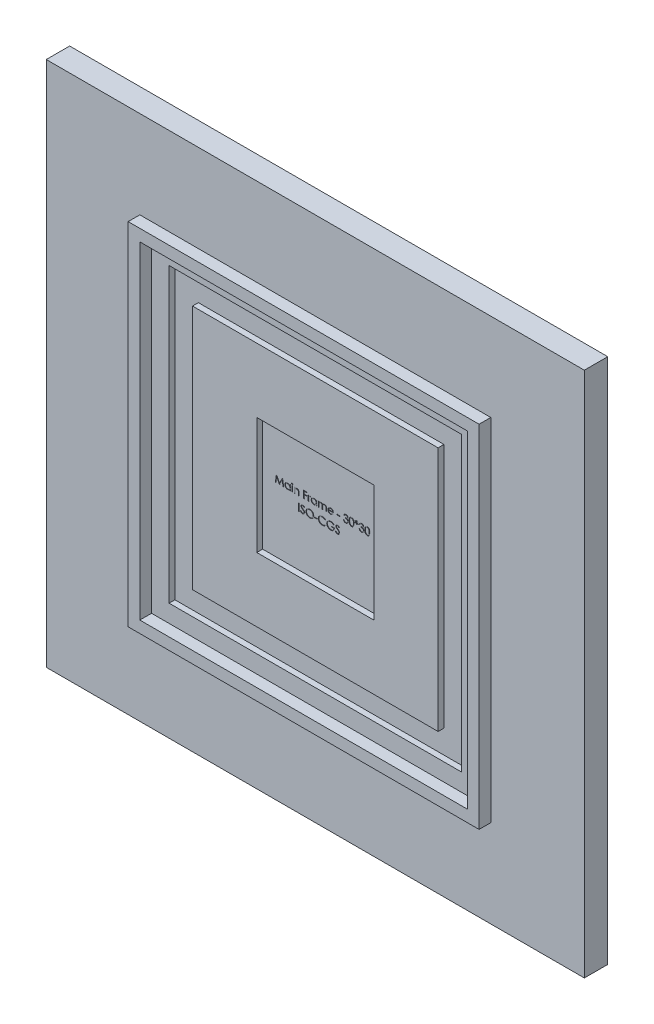
from build123d import *

# Parameters (mm, degrees)
SKETCH_2_W          = 460
SKETCH_2_H          = 450
EXTRUDE_1_DEPTH     = 20
SKETCH_3_W          = 300
SKETCH_3_H          = 300
SKETCH_3_W_2        = 280
SKETCH_3_H_2        = 280
EXTRUDE_2_DEPTH     = 10
SKETCH_6_W          = 250
SKETCH_6_H          = 250
SKETCH_6_W_2        = 210
SKETCH_6_H_2        = 210
SKETCH_6_W_3        = 100
SKETCH_6_H_3        = 100
CUT_EXTRUDE_2_DEPTH = 5
SKETCH_7_W          = 0.569871795
SKETCH_7_H          = 4.640384616
SKETCH_7_W_2        = 2.442307693
SKETCH_7_H_2        = 0.651282051
SKETCH_7_H_3        = 6.35
CUT_EXTRUDE_3_DEPTH = 0.4


with BuildPart() as part:
    # 스케치2 → 보스-돌출1 (new body)
    with BuildSketch(Plane.XY):
        Rectangle(SKETCH_2_W, SKETCH_2_H)
    extrude(amount=EXTRUDE_1_DEPTH)

    # 스케치3 → 보스-돌출2 (add)
    with BuildSketch(Plane.XY.offset(20)):
        Rectangle(SKETCH_3_W, SKETCH_3_H)
        Rectangle(SKETCH_3_W_2, SKETCH_3_H_2, mode=Mode.SUBTRACT)
    extrude(amount=EXTRUDE_2_DEPTH)

    # 스케치6 → 컷-돌출2 (cut)
    # profile 1 of 2: a face of its own
    with BuildSketch(Plane.XY.offset(20)):
        Rectangle(SKETCH_6_W, SKETCH_6_H)
        Rectangle(SKETCH_6_W_2, SKETCH_6_H_2, mode=Mode.SUBTRACT)
    # profile 2 of 2: a face of its own
    with BuildSketch(Plane.XY.offset(20)):
        Rectangle(SKETCH_6_W_3, SKETCH_6_H_3)
    extrude(amount=-CUT_EXTRUDE_2_DEPTH, mode=Mode.SUBTRACT)

    # 스케치7 → 컷-돌출3 (cut)
    # profile 1 of 23: a face of its own
    with BuildSketch(Plane.XY.offset(15)):
        Polygon((-39.106120256, 4.949322724), (-38.267849022, 11.299322724), (-38.186438765, 11.299322724), (-35.564774102, 6.089066314), (-32.949469615, 11.299322724), (-32.866787323, 11.299322724), (-32.023427948, 4.949322724), (-32.595843813, 4.949322724), (-33.203876666, 9.518473365), (-35.496084198, 4.949322724), (-35.624559759, 4.949322724), (-37.925671538, 9.528649647), (-38.532432355, 4.949322724), align=None)
    # profile 2 of 23: a face of its own
    with BuildSketch(Plane.XY.offset(15)):
        with BuildLine():
            Line((-26.161889486, 9.58970734), (-26.161889486, 4.949322724))
            Line((-26.161889486, 4.949322724), (-26.731761281, 4.949322724))
            Line((-26.731761281, 4.949322724), (-26.731761281, 5.751976971))
            add(Edge.make_bspline(
                [(-26.731761281, 5.751976971), (-26.796021087, 5.679333708), (-26.921424906, 5.537569466), (-27.130868077, 5.352363239), (-27.352878914, 5.199276855), (-27.586379883, 5.075633437), (-27.831160124, 4.98275642), (-28.086677026, 4.916741532), (-28.353034817, 4.874298431), (-28.534921232, 4.87006022), (-28.627093813, 4.867912468)],
                knots=[0, 0, 0, 0, 1.074387032, 2.096679803, 3.090159297, 4.057316773, 5.018401886, 5.985159533, 6.978961417, 8, 8, 8, 8], degree=3))
            add(Edge.make_bspline(
                [(-28.627093813, 4.867912468), (-28.709041387, 4.870137458), (-28.87064563, 4.874525236), (-29.108369813, 4.908565415), (-29.33713718, 4.963230972), (-29.557163904, 5.039251157), (-29.767026225, 5.140090647), (-29.968520972, 5.260815483), (-30.160604285, 5.404580989), (-30.340348363, 5.568933555), (-30.505869277, 5.747450175), (-30.651123301, 5.937851381), (-30.77223246, 6.139313847), (-30.873506035, 6.349286854), (-30.951513688, 6.56938678), (-31.005894425, 6.798852499), (-31.039894949, 7.037412698), (-31.044280914, 7.199862976), (-31.046504871, 7.282235385)],
                knots=[0, 0, 0, 0, 1.033919861, 2.038935746, 3.024066025, 3.998881131, 4.97069526, 5.957263378, 6.95902576, 7.993208707, 9.027059324, 10.027763471, 11.009749337, 11.988697705, 12.965288445, 13.950418724, 14.960734635, 16, 16, 16, 16], degree=3))
            add(Edge.make_bspline(
                [(-31.046504871, 7.282235385), (-31.044231623, 7.362905247), (-31.039737534, 7.522385212), (-31.006258121, 7.756933707), (-30.949959005, 7.982845409), (-30.870950767, 8.199393006), (-30.769637506, 8.406838526), (-30.646396548, 8.605328685), (-30.501218993, 8.795410306), (-30.333846769, 8.972613818), (-30.152536543, 9.136299789), (-29.95857356, 9.2785562), (-29.75678275, 9.401413912), (-29.544034145, 9.498756647), (-29.323476683, 9.577513166), (-29.09314686, 9.632001551), (-28.854002996, 9.664109548), (-28.691641675, 9.668759134), (-28.60928532, 9.671117596)],
                knots=[0, 0, 0, 0, 1.020392517, 2.01726096, 2.990465484, 3.961182959, 4.928053699, 5.906110375, 6.912531644, 7.948652711, 8.985773172, 9.998621852, 10.987621588, 11.969261332, 12.953316658, 13.946091881, 14.958173133, 16, 16, 16, 16], degree=3))
            add(Edge.make_bspline(
                [(-28.60928532, 9.671117596), (-28.514579861, 9.668509104), (-28.328866927, 9.663393974), (-28.057217538, 9.620825883), (-27.800233986, 9.548910378), (-27.555932518, 9.451088632), (-27.325190416, 9.321097366), (-27.110192145, 9.157122294), (-26.908687625, 8.960197569), (-26.791883382, 8.808939763), (-26.731761281, 8.731083542)],
                knots=[0, 0, 0, 0, 1.038897134, 2.037228247, 3.008116434, 3.962042015, 4.918381754, 5.904844433, 6.921570401, 8, 8, 8, 8], degree=3))
            Line((-26.731761281, 8.731083542), (-26.731761281, 9.58970734))
            Line((-26.731761281, 9.58970734), (-26.161889486, 9.58970734))
        make_face()
        with BuildLine():
            add(Edge.make_bspline(
                [(-28.601653108, 9.101245801), (-28.684954835, 9.098281916), (-28.849379195, 9.092431677), (-29.090759028, 9.046759764), (-29.321741936, 8.970769143), (-29.541172671, 8.866843408), (-29.745585007, 8.7361627), (-29.928272095, 8.578099619), (-30.090728139, 8.39696675), (-30.227358847, 8.193581493), (-30.338738749, 7.975544099), (-30.417056078, 7.747625476), (-30.468707427, 7.513936445), (-30.473984314, 7.355435572), (-30.476633076, 7.275875208)],
                knots=[0, 0, 0, 0, 1.031046209, 2.035121221, 3.029706178, 4.034933723, 5.034054252, 6.02443088, 7.017295772, 8.038157696, 9.050218397, 10.03989886, 11.016116709, 12, 12, 12, 12], degree=3))
            add(Edge.make_bspline(
                [(-30.476633076, 7.275875208), (-30.473249627, 7.196790299), (-30.46649599, 7.038930468), (-30.417962588, 6.80492285), (-30.336537674, 6.576950517), (-30.225427075, 6.356948429), (-30.086295627, 6.152688704), (-29.925026215, 5.968103053), (-29.740059276, 5.809371943), (-29.535176513, 5.676498059), (-29.316359195, 5.569160343), (-29.086246205, 5.494474111), (-28.849163262, 5.446254423), (-28.687959742, 5.440622015), (-28.606741249, 5.437784263)],
                knots=[0, 0, 0, 0, 0.979072187, 1.954306742, 2.945804271, 3.96968567, 4.997920485, 5.998718438, 6.996577872, 8.005894225, 9.015743152, 10.005417472, 10.995077863, 12, 12, 12, 12], degree=3))
            add(Edge.make_bspline(
                [(-28.606741249, 5.437784263), (-28.524288308, 5.440795912), (-28.360297587, 5.446785782), (-28.118201646, 5.492653221), (-27.883260785, 5.568433755), (-27.658675385, 5.673479314), (-27.449458975, 5.803667659), (-27.261684254, 5.956080524), (-27.102905283, 6.133342016), (-26.968298692, 6.32815358), (-26.862751864, 6.541716774), (-26.785869585, 6.769108806), (-26.740414642, 7.010337592), (-26.734685618, 7.175190716), (-26.731761281, 7.25933875)],
                knots=[0, 0, 0, 0, 1.01762866, 2.023962475, 3.030623092, 4.058876274, 5.077231937, 6.066672613, 7.034107872, 8.005628644, 8.981990164, 9.965428785, 10.961468474, 12, 12, 12, 12], degree=3))
            add(Edge.make_bspline(
                [(-26.731761281, 7.25933875), (-26.733502372, 7.323451671), (-26.73692939, 7.449646189), (-26.763110566, 7.634934685), (-26.804757361, 7.812251588), (-26.863442555, 7.981783324), (-26.940533886, 8.142592566), (-27.033511975, 8.295833959), (-27.144011862, 8.4407105), (-27.270254754, 8.575227214), (-27.408440193, 8.697920939), (-27.554661717, 8.807438918), (-27.710651729, 8.89740712), (-27.873786924, 8.971867713), (-28.044350346, 9.031120742), (-28.223729899, 9.070649844), (-28.410018918, 9.09779214), (-28.537102475, 9.10008246), (-28.601653108, 9.101245801)],
                knots=[0, 0, 0, 0, 1.050140795, 2.067009409, 3.05949893, 4.030605086, 5.00011959, 5.97591094, 6.962425594, 7.979863591, 8.993523472, 9.986985069, 10.967611495, 11.937549037, 12.921786183, 13.919465291, 14.943216303, 16, 16, 16, 16], degree=3))
        make_face(mode=Mode.SUBTRACT)
    # profile 3 of 23: a face of its own
    with BuildSketch(Plane.XY.offset(15)):
        with BuildLine():
            add(Edge.make_bspline(
                [(-24.658343813, 11.543553493), (-24.622980998, 11.541913103), (-24.553733812, 11.538700903), (-24.453597455, 11.511193651), (-24.362416876, 11.464567079), (-24.281540132, 11.402011087), (-24.212140281, 11.328442811), (-24.16355242, 11.242697911), (-24.132324216, 11.150062952), (-24.128553123, 11.085447005), (-24.126633076, 11.052547885)],
                knots=[0, 0, 0, 0, 1.055194115, 2.066272739, 3.074728998, 4.095836921, 5.109056067, 6.073838105, 7.019297344, 8, 8, 8, 8], degree=3))
            add(Edge.make_bspline(
                [(-24.126633076, 11.052547885), (-24.128596423, 11.020502785), (-24.132477728, 10.957153416), (-24.1635283, 10.866124403), (-24.21255436, 10.781570917), (-24.281495631, 10.708145486), (-24.362428668, 10.645624075), (-24.453594323, 10.598988334), (-24.553734636, 10.571483514), (-24.622981276, 10.568270978), (-24.658343813, 10.566630417)],
                knots=[0, 0, 0, 0, 0.96129708, 1.900370562, 2.859976407, 3.87933698, 4.906634145, 5.921202961, 6.938410037, 8, 8, 8, 8], degree=3))
            add(Edge.make_bspline(
                [(-24.658343813, 10.566630417), (-24.69330197, 10.568208338), (-24.761343454, 10.571279555), (-24.859980439, 10.599528015), (-24.950383556, 10.645640034), (-25.031418033, 10.707736112), (-25.098964241, 10.782021854), (-25.148128345, 10.866072802), (-25.179107205, 10.957166554), (-25.182998174, 11.020507198), (-25.184966409, 11.052547885)],
                knots=[0, 0, 0, 0, 1.054934014, 2.053291228, 3.073705704, 4.106921865, 5.123545215, 6.088680038, 7.033164197, 8, 8, 8, 8], degree=3))
            add(Edge.make_bspline(
                [(-25.184966409, 11.052547885), (-25.183041295, 11.085442426), (-25.179260249, 11.150049381), (-25.148105124, 11.242750369), (-25.099373759, 11.327988237), (-25.031373308, 11.402420214), (-24.950395458, 11.464551217), (-24.859977364, 11.510653998), (-24.761344266, 11.538904857), (-24.693302245, 11.541975743), (-24.658343813, 11.543553493)],
                knots=[0, 0, 0, 0, 0.98631895, 1.937192651, 2.907499808, 3.917963147, 4.944918757, 5.95915025, 6.951458133, 8, 8, 8, 8], degree=3))
        make_face()
    # profile 4 of 23: a face of its own
    with BuildSketch(Plane.XY.offset(15)):
        with Locations((-24.655799743, 7.269515032)):
            Rectangle(SKETCH_7_W, SKETCH_7_H)
    # profile 5 of 23: a face of its own
    with BuildSketch(Plane.XY.offset(15)):
        with BuildLine():
            Line((-22.986889486, 9.58970734), (-22.417017692, 9.58970734))
            Line((-22.417017692, 9.58970734), (-22.417017692, 8.752708141))
            add(Edge.make_bspline(
                [(-22.417017692, 8.752708141), (-22.356170839, 8.828622795), (-22.238095399, 8.97593783), (-22.041455252, 9.169559444), (-21.83363989, 9.32911721), (-21.615921969, 9.456305522), (-21.388005937, 9.5521844), (-21.151281075, 9.621428304), (-20.904330109, 9.662947921), (-20.736391773, 9.668373054), (-20.651432756, 9.671117596)],
                knots=[0, 0, 0, 0, 1.12780773, 2.188550248, 3.19190651, 4.159438251, 5.104880172, 6.052711206, 7.014878035, 8, 8, 8, 8], degree=3))
            add(Edge.make_bspline(
                [(-20.651432756, 9.671117596), (-20.565561462, 9.667951313), (-20.397490628, 9.661754133), (-20.152783288, 9.612738136), (-19.924231559, 9.529017459), (-19.712650365, 9.414332703), (-19.521919564, 9.271718101), (-19.354415905, 9.10556984), (-19.215871156, 8.914460089), (-19.122984512, 8.737162363), (-19.061796551, 8.579884122), (-19.023275024, 8.445179303), (-18.990561672, 8.295104943), (-18.962201215, 8.130114546), (-18.943011312, 7.949052115), (-18.927876012, 7.752659874), (-18.917028952, 7.541001437), (-18.916598591, 7.394612842), (-18.916376666, 7.319124407)],
                knots=[0, 0, 0, 0, 1.235846778, 2.418850247, 3.575807741, 4.728682307, 5.871620074, 6.994088408, 8.11269785, 9.256955736, 9.865816715, 10.540099792, 11.271859618, 12.076849838, 12.949306005, 13.892391288, 14.913166135, 16, 16, 16, 16], degree=3))
            Line((-18.916376666, 7.319124407), (-18.916376666, 4.949322724))
            Line((-18.916376666, 4.949322724), (-19.486248461, 4.949322724))
            Line((-19.486248461, 4.949322724), (-19.486248461, 7.132135224))
            add(Edge.make_bspline(
                [(-19.486248461, 7.132135224), (-19.486598995, 7.195313089), (-19.487269508, 7.316161591), (-19.489384324, 7.489188247), (-19.494482116, 7.646099611), (-19.501645484, 7.786520549), (-19.512130297, 7.910316224), (-19.523057071, 8.017738769), (-19.536419243, 8.108651796), (-19.548326242, 8.163379874), (-19.553666329, 8.187924487)],
                knots=[0, 0, 0, 0, 1.430800155, 2.736877192, 3.918605307, 4.986035426, 5.920637409, 6.731861385, 7.431261377, 8, 8, 8, 8], degree=3))
            add(Edge.make_bspline(
                [(-19.553666329, 8.187924487), (-19.572944079, 8.259971923), (-19.610047784, 8.398640945), (-19.701730867, 8.586735842), (-19.817508024, 8.746752554), (-19.958836979, 8.877701749), (-20.124352588, 8.979611696), (-20.313595547, 9.050321585), (-20.524739652, 9.094547102), (-20.673246889, 9.098950613), (-20.750651506, 9.101245801)],
                knots=[0, 0, 0, 0, 1.084156227, 2.086665306, 3.027808233, 3.945421172, 4.874247719, 5.839848303, 6.874090471, 8, 8, 8, 8], degree=3))
            add(Edge.make_bspline(
                [(-20.750651506, 9.101245801), (-20.796494303, 9.100382193), (-20.887216015, 9.098673134), (-21.021745249, 9.081525779), (-21.152236249, 9.053479724), (-21.279998628, 9.015618053), (-21.402477054, 8.963616507), (-21.523606554, 8.904598936), (-21.638825969, 8.831032894), (-21.750592132, 8.749044195), (-21.85457394, 8.658186205), (-21.951326783, 8.562311165), (-22.037574334, 8.460211141), (-22.115713216, 8.353531236), (-22.183165208, 8.24080633), (-22.242044382, 8.123123945), (-22.292002, 8.00032919), (-22.316826314, 7.915103007), (-22.329247259, 7.872459743)],
                knots=[0, 0, 0, 0, 1.023777757, 2.026029729, 3.023749952, 4.003683103, 4.997618607, 5.993177895, 7.010360494, 8.046726602, 9.087585522, 10.09234134, 11.086953743, 12.070360549, 13.043493632, 14.017870808, 15.008233677, 16, 16, 16, 16], degree=3))
            add(Edge.make_bspline(
                [(-22.329247259, 7.872459743), (-22.336394907, 7.841153875), (-22.351954963, 7.773002637), (-22.368761018, 7.661162048), (-22.384014762, 7.531785379), (-22.396781815, 7.385023604), (-22.404593071, 7.220362887), (-22.413110048, 7.038506439), (-22.416210773, 6.83872911), (-22.416741187, 6.699642896), (-22.417017692, 6.627137227)],
                knots=[0, 0, 0, 0, 0.615963638, 1.340920617, 2.168419149, 3.115676021, 4.16674242, 5.331190069, 6.6087489, 8, 8, 8, 8], degree=3))
            Line((-22.417017692, 6.627137227), (-22.417017692, 4.949322724))
            Line((-22.417017692, 4.949322724), (-22.986889486, 4.949322724))
            Line((-22.986889486, 4.949322724), (-22.986889486, 9.58970734))
        make_face()
    # profile 6 of 23: a face of its own
    with BuildSketch(Plane.XY.offset(15)):
        Polygon((-15.008684358, 11.299322724), (-11.915094615, 11.299322724), (-11.915094615, 10.648040673), (-14.438812563, 10.648040673), (-14.438812563, 8.694194519), (-11.915094615, 8.694194519), (-11.915094615, 8.042912468), (-14.438812563, 8.042912468), (-14.438812563, 4.949322724), (-15.008684358, 4.949322724), align=None)
    # profile 7 of 23: a face of its own
    with BuildSketch(Plane.XY.offset(15)):
        with BuildLine():
            Line((-11.10099205, 9.58970734), (-10.531120256, 9.58970734))
            Line((-10.531120256, 9.58970734), (-10.531120256, 8.906624407))
            add(Edge.make_bspline(
                [(-10.531120256, 8.906624407), (-10.489049222, 8.970225695), (-10.408588697, 9.091862666), (-10.274852382, 9.252734112), (-10.137867767, 9.385929982), (-9.99697907, 9.49207208), (-9.851150231, 9.571561596), (-9.703581762, 9.629787531), (-9.551951981, 9.664217803), (-9.450058204, 9.668814584), (-9.399008877, 9.671117596)],
                knots=[0, 0, 0, 0, 1.2804753, 2.448899062, 3.506932113, 4.484331642, 5.4025378, 6.288909075, 7.142734305, 8, 8, 8, 8], degree=3))
            add(Edge.make_bspline(
                [(-9.399008877, 9.671117596), (-9.359409685, 9.668957641), (-9.277931773, 9.664513392), (-9.154591932, 9.633288039), (-9.027513098, 9.583435055), (-8.945611909, 9.536553508), (-8.902915127, 9.512113189)],
                knots=[0, 0, 0, 0, 0.901110191, 1.854092781, 2.881294221, 4, 4, 4, 4], degree=3))
            Line((-8.902915127, 9.512113189), (-9.2158358, 9.01856351))
            add(Edge.make_bspline(
                [(-9.2158358, 9.01856351), (-9.243247882, 9.030792278), (-9.295281259, 9.054004822), (-9.37139883, 9.081476754), (-9.441577826, 9.097652773), (-9.486288282, 9.100103361), (-9.507131874, 9.101245801)],
                knots=[0, 0, 0, 0, 1.180555205, 2.24091978, 3.179933427, 4, 4, 4, 4], degree=3))
            add(Edge.make_bspline(
                [(-9.507131874, 9.101245801), (-9.552862276, 9.098197733), (-9.646139041, 9.091980559), (-9.78308949, 9.043105865), (-9.915980849, 8.964138643), (-10.021520865, 8.876561055), (-10.10324038, 8.792110051), (-10.161551932, 8.718362234), (-10.215042059, 8.635669574), (-10.266150888, 8.54544572), (-10.312716878, 8.446150142), (-10.356177493, 8.338774883), (-10.395472858, 8.223195578), (-10.41787973, 8.142673006), (-10.429357435, 8.10142609)],
                knots=[0, 0, 0, 0, 1.125678352, 2.296057538, 3.5422874, 4.923748041, 5.663163013, 6.437101912, 7.23742474, 8.08941207, 8.991984279, 9.93940061, 10.944477711, 12, 12, 12, 12], degree=3))
            add(Edge.make_bspline(
                [(-10.429357435, 8.10142609), (-10.437943349, 8.064637503), (-10.456960495, 7.98315358), (-10.475450857, 7.846449828), (-10.493719839, 7.684935476), (-10.506595133, 7.498160943), (-10.51852958, 7.286592652), (-10.52526073, 7.049908293), (-10.530890713, 6.787864928), (-10.53104142, 6.604668601), (-10.531120256, 6.508837949)],
                knots=[0, 0, 0, 0, 0.566838948, 1.255505196, 2.06880316, 3.007127437, 4.065329342, 5.249902469, 6.561414163, 8, 8, 8, 8], degree=3))
            Line((-10.531120256, 6.508837949), (-10.531120256, 4.949322724))
            Line((-10.531120256, 4.949322724), (-11.10099205, 4.949322724))
            Line((-11.10099205, 4.949322724), (-11.10099205, 9.58970734))
        make_face()
    # profile 8 of 23: a face of its own
    with BuildSketch(Plane.XY.offset(15)):
        with BuildLine():
            Line((-3.611248461, 9.58970734), (-3.611248461, 4.949322724))
            Line((-3.611248461, 4.949322724), (-4.181120256, 4.949322724))
            Line((-4.181120256, 4.949322724), (-4.181120256, 5.751976971))
            add(Edge.make_bspline(
                [(-4.181120256, 5.751976971), (-4.245380061, 5.679333708), (-4.370783881, 5.537569466), (-4.580227052, 5.352363239), (-4.802237889, 5.199276855), (-5.035738857, 5.075633437), (-5.280519099, 4.98275642), (-5.536036, 4.916741532), (-5.802393791, 4.874298431), (-5.984280206, 4.87006022), (-6.076452788, 4.867912468)],
                knots=[0, 0, 0, 0, 1.074387032, 2.096679803, 3.090159297, 4.057316773, 5.018401886, 5.985159533, 6.978961417, 8, 8, 8, 8], degree=3))
            add(Edge.make_bspline(
                [(-6.076452788, 4.867912468), (-6.158400361, 4.870137458), (-6.320004604, 4.874525236), (-6.557728787, 4.908565415), (-6.786496154, 4.963230972), (-7.006522879, 5.039251157), (-7.2163852, 5.140090647), (-7.417879946, 5.260815483), (-7.609963259, 5.404580989), (-7.789707337, 5.568933555), (-7.955228252, 5.747450175), (-8.100482275, 5.937851381), (-8.221591434, 6.139313847), (-8.322865009, 6.349286854), (-8.400872663, 6.56938678), (-8.455253399, 6.798852499), (-8.489253924, 7.037412698), (-8.493639888, 7.199862976), (-8.495863845, 7.282235385)],
                knots=[0, 0, 0, 0, 1.033919861, 2.038935746, 3.024066025, 3.998881131, 4.97069526, 5.957263378, 6.95902576, 7.993208707, 9.027059324, 10.027763471, 11.009749337, 11.988697705, 12.965288445, 13.950418724, 14.960734635, 16, 16, 16, 16], degree=3))
            add(Edge.make_bspline(
                [(-8.495863845, 7.282235385), (-8.493590597, 7.362905247), (-8.489096508, 7.522385212), (-8.455617095, 7.756933707), (-8.39931798, 7.982845409), (-8.320309742, 8.199393006), (-8.218996481, 8.406838526), (-8.095755523, 8.605328685), (-7.950577968, 8.795410306), (-7.783205744, 8.972613818), (-7.601895518, 9.136299789), (-7.407932535, 9.2785562), (-7.206141724, 9.401413912), (-6.993393119, 9.498756647), (-6.772835658, 9.577513166), (-6.542505835, 9.632001551), (-6.303361971, 9.664109548), (-6.141000649, 9.668759134), (-6.058644294, 9.671117596)],
                knots=[0, 0, 0, 0, 1.020392517, 2.01726096, 2.990465484, 3.961182959, 4.928053699, 5.906110375, 6.912531644, 7.948652711, 8.985773172, 9.998621852, 10.987621588, 11.969261332, 12.953316658, 13.946091881, 14.958173133, 16, 16, 16, 16], degree=3))
            add(Edge.make_bspline(
                [(-6.058644294, 9.671117596), (-5.963938835, 9.668509104), (-5.778225901, 9.663393974), (-5.506576513, 9.620825883), (-5.24959296, 9.548910378), (-5.005291493, 9.451088632), (-4.774549391, 9.321097366), (-4.559551119, 9.157122294), (-4.3580466, 8.960197569), (-4.241242356, 8.808939763), (-4.181120256, 8.731083542)],
                knots=[0, 0, 0, 0, 1.038897134, 2.037228247, 3.008116434, 3.962042015, 4.918381754, 5.904844433, 6.921570401, 8, 8, 8, 8], degree=3))
            Line((-4.181120256, 8.731083542), (-4.181120256, 9.58970734))
            Line((-4.181120256, 9.58970734), (-3.611248461, 9.58970734))
        make_face()
        with BuildLine():
            add(Edge.make_bspline(
                [(-6.051012083, 9.101245801), (-6.13431381, 9.098281916), (-6.29873817, 9.092431677), (-6.540118002, 9.046759764), (-6.77110091, 8.970769143), (-6.990531645, 8.866843408), (-7.194943981, 8.7361627), (-7.37763107, 8.578099619), (-7.540087113, 8.39696675), (-7.676717821, 8.193581493), (-7.788097723, 7.975544099), (-7.866415052, 7.747625476), (-7.918066401, 7.513936445), (-7.923343289, 7.355435572), (-7.92599205, 7.275875208)],
                knots=[0, 0, 0, 0, 1.031046209, 2.035121221, 3.029706178, 4.034933723, 5.034054252, 6.02443088, 7.017295772, 8.038157696, 9.050218397, 10.03989886, 11.016116709, 12, 12, 12, 12], degree=3))
            add(Edge.make_bspline(
                [(-7.92599205, 7.275875208), (-7.922608601, 7.196790299), (-7.915854965, 7.038930468), (-7.867321562, 6.80492285), (-7.785896649, 6.576950517), (-7.674786049, 6.356948429), (-7.535654601, 6.152688704), (-7.374385189, 5.968103053), (-7.18941825, 5.809371943), (-6.984535487, 5.676498059), (-6.765718169, 5.569160343), (-6.535605179, 5.494474111), (-6.298522236, 5.446254423), (-6.137318716, 5.440622015), (-6.056100224, 5.437784263)],
                knots=[0, 0, 0, 0, 0.979072187, 1.954306742, 2.945804271, 3.96968567, 4.997920485, 5.998718438, 6.996577872, 8.005894225, 9.015743152, 10.005417472, 10.995077863, 12, 12, 12, 12], degree=3))
            add(Edge.make_bspline(
                [(-6.056100224, 5.437784263), (-5.973647283, 5.440795912), (-5.809656562, 5.446785782), (-5.56756062, 5.492653221), (-5.332619759, 5.568433755), (-5.108034359, 5.673479314), (-4.89881795, 5.803667659), (-4.711043229, 5.956080524), (-4.552264258, 6.133342016), (-4.417657666, 6.32815358), (-4.312110839, 6.541716774), (-4.23522856, 6.769108806), (-4.189773616, 7.010337592), (-4.184044593, 7.175190716), (-4.181120256, 7.25933875)],
                knots=[0, 0, 0, 0, 1.01762866, 2.023962475, 3.030623092, 4.058876274, 5.077231937, 6.066672613, 7.034107872, 8.005628644, 8.981990164, 9.965428785, 10.961468474, 12, 12, 12, 12], degree=3))
            add(Edge.make_bspline(
                [(-4.181120256, 7.25933875), (-4.182861346, 7.323451671), (-4.186288364, 7.449646189), (-4.21246954, 7.634934685), (-4.254116335, 7.812251588), (-4.31280153, 7.981783324), (-4.38989286, 8.142592566), (-4.482870949, 8.295833959), (-4.593370837, 8.4407105), (-4.719613728, 8.575227214), (-4.857799167, 8.697920939), (-5.004020691, 8.807438918), (-5.160010703, 8.89740712), (-5.323145899, 8.971867713), (-5.49370932, 9.031120742), (-5.673088873, 9.070649844), (-5.859377892, 9.09779214), (-5.98646145, 9.10008246), (-6.051012083, 9.101245801)],
                knots=[0, 0, 0, 0, 1.050140795, 2.067009409, 3.05949893, 4.030605086, 5.00011959, 5.97591094, 6.962425594, 7.979863591, 8.993523472, 9.986985069, 10.967611495, 11.937549037, 12.921786183, 13.919465291, 14.943216303, 16, 16, 16, 16], degree=3))
        make_face(mode=Mode.SUBTRACT)
    # profile 9 of 23: a face of its own
    with BuildSketch(Plane.XY.offset(15)):
        with BuildLine():
            Line((-2.308684358, 9.58970734), (-1.738812563, 9.58970734))
            Line((-1.738812563, 9.58970734), (-1.738812563, 8.783236987))
            add(Edge.make_bspline(
                [(-1.738812563, 8.783236987), (-1.687497397, 8.853790207), (-1.589172619, 8.988976941), (-1.427944935, 9.167122171), (-1.266879702, 9.318303252), (-1.150886281, 9.397665319), (-1.095162724, 9.435791074)],
                knots=[0, 0, 0, 0, 1.134379233, 2.173579362, 3.122582517, 4, 4, 4, 4], degree=3))
            add(Edge.make_bspline(
                [(-1.095162724, 9.435791074), (-1.019208265, 9.472086522), (-0.868626361, 9.544043295), (-0.630194339, 9.617038466), (-0.386218867, 9.661896864), (-0.221466822, 9.668031642), (-0.138592211, 9.671117596)],
                knots=[0, 0, 0, 0, 1.014936303, 2.012140481, 3.000054389, 4, 4, 4, 4], degree=3))
            add(Edge.make_bspline(
                [(-0.138592211, 9.671117596), (-0.082543488, 9.66922114), (0.028373919, 9.665468155), (0.19271934, 9.641047806), (0.352119964, 9.59883632), (0.505633989, 9.540040175), (0.650270078, 9.468835472), (0.782874766, 9.385288145), (0.901935829, 9.291494879), (1.007393094, 9.183220244), (1.10222404, 9.057423844), (1.189452804, 8.910712992), (1.270052833, 8.739793378), (1.314722921, 8.61575694), (1.338240722, 8.550454535)],
                knots=[0, 0, 0, 0, 1.009824226, 1.998387844, 2.986035974, 3.974953746, 4.955485308, 5.885931332, 6.793869504, 7.679848016, 8.601185859, 9.625726857, 10.749998409, 12, 12, 12, 12], degree=3))
            add(Edge.make_bspline(
                [(1.338240722, 8.550454535), (1.363116849, 8.595311696), (1.412069575, 8.683584289), (1.494266945, 8.80851285), (1.58038709, 8.925365172), (1.671163956, 9.034233971), (1.766277135, 9.134581625), (1.866174247, 9.226739903), (1.970286636, 9.311104577), (2.115052557, 9.409662309), (2.303398288, 9.514348738), (2.540866724, 9.605114629), (2.787882036, 9.661205319), (2.955554145, 9.667791671), (3.040223895, 9.671117596)],
                knots=[0, 0, 0, 0, 0.86119277, 1.694706429, 2.50939023, 3.298075842, 4.073795165, 4.829715201, 5.57930267, 6.321991688, 7.768977793, 9.186738141, 10.579381044, 12, 12, 12, 12], degree=3))
            add(Edge.make_bspline(
                [(3.040223895, 9.671117596), (3.11802312, 9.668183495), (3.270283758, 9.662441175), (3.491948226, 9.617349874), (3.698671216, 9.539920428), (3.890036768, 9.434267973), (4.062683858, 9.301500027), (4.212754876, 9.143532278), (4.33933825, 8.961482091), (4.422030925, 8.790228054), (4.478120047, 8.63903395), (4.512702572, 8.51020825), (4.54325459, 8.368419004), (4.568620564, 8.213496673), (4.587159937, 8.044893998), (4.600895378, 7.862886894), (4.610191911, 7.667333906), (4.610848814, 7.532413641), (4.611187437, 7.462864391)],
                knots=[0, 0, 0, 0, 1.209669288, 2.367440248, 3.500751976, 4.631527125, 5.755587489, 6.87532382, 8.007944318, 9.190864318, 9.82315674, 10.514484317, 11.263564316, 12.079023757, 12.955305781, 13.901327259, 14.918167583, 16, 16, 16, 16], degree=3))
            Line((4.611187437, 7.462864391), (4.611187437, 4.949322724))
            Line((4.611187437, 4.949322724), (4.041315642, 4.949322724))
            Line((4.041315642, 4.949322724), (4.041315642, 7.465408461))
            add(Edge.make_bspline(
                [(4.041315642, 7.465408461), (4.04117434, 7.524772931), (4.040902779, 7.638862414), (4.036015762, 7.802606147), (4.026807692, 7.951864452), (4.016040562, 8.086433812), (4.001083936, 8.206628043), (3.981769174, 8.312205716), (3.961308241, 8.403997346), (3.9273158, 8.50575346), (3.872981768, 8.618003699), (3.790218625, 8.73905933), (3.685951433, 8.844434496), (3.565555148, 8.935907728), (3.428488685, 9.010281905), (3.277422687, 9.063396951), (3.11329505, 9.096277031), (2.99967942, 9.099553659), (2.941005145, 9.101245801)],
                knots=[0, 0, 0, 0, 1.253487763, 2.409012846, 3.458416907, 4.410876679, 5.259312806, 6.014470957, 6.676830364, 7.243083969, 8.276244668, 9.299465089, 10.325150304, 11.392391894, 12.482080715, 13.603491619, 14.762376348, 16, 16, 16, 16], degree=3))
            add(Edge.make_bspline(
                [(2.941005145, 9.101245801), (2.869032514, 9.098676487), (2.726787232, 9.093598546), (2.519150421, 9.041757376), (2.319631577, 8.963597493), (2.134184121, 8.850327178), (1.963590844, 8.714603432), (1.816815896, 8.553223451), (1.695563216, 8.370652012), (1.613459574, 8.201657281), (1.561590413, 8.049857004), (1.527342295, 7.917237486), (1.500702427, 7.766503785), (1.475718753, 7.598668765), (1.459412446, 7.412577153), (1.444592685, 7.209089768), (1.437660548, 6.987594584), (1.436690887, 6.834057592), (1.436187437, 6.754340753)],
                knots=[0, 0, 0, 0, 1.090531906, 2.155305635, 3.229839962, 4.33261226, 5.44038871, 6.529323825, 7.629011124, 8.757537029, 9.370236727, 10.061839251, 10.834451254, 11.692844982, 12.636905849, 13.66920014, 14.789842145, 16, 16, 16, 16], degree=3))
            Line((1.436187437, 6.754340753), (1.436187437, 4.949322724))
            Line((1.436187437, 4.949322724), (0.866315642, 4.949322724))
            Line((0.866315642, 4.949322724), (0.866315642, 7.308948125))
            add(Edge.make_bspline(
                [(0.866315642, 7.308948125), (0.866171531, 7.375520289), (0.865894277, 7.503598441), (0.861038673, 7.687265252), (0.851810088, 7.85432664), (0.841141093, 8.004588439), (0.825791912, 8.137777564), (0.808357058, 8.254608054), (0.787767436, 8.354787016), (0.753677217, 8.4646663), (0.701580967, 8.585717118), (0.617782263, 8.714787256), (0.513265653, 8.827759376), (0.390672778, 8.924204534), (0.252776755, 9.003926936), (0.100406871, 9.061366771), (-0.0650649, 9.094793696), (-0.179143023, 9.09905454), (-0.237810961, 9.101245801)],
                knots=[0, 0, 0, 0, 1.320475261, 2.540461679, 3.643808994, 4.639130445, 5.527981419, 6.302341397, 6.981980563, 7.553956391, 8.582137848, 9.585246428, 10.591171744, 11.620968678, 12.668337649, 13.738356861, 14.836885341, 16, 16, 16, 16], degree=3))
            add(Edge.make_bspline(
                [(-0.237810961, 9.101245801), (-0.30678323, 9.098469109), (-0.444242514, 9.092935261), (-0.646176087, 9.043125365), (-0.841185827, 8.965103686), (-1.026160781, 8.856863729), (-1.19611245, 8.722789686), (-1.344898878, 8.565101232), (-1.469980317, 8.385760843), (-1.552950895, 8.218548077), (-1.606469556, 8.07055085), (-1.642021091, 7.944728416), (-1.672572984, 7.805027966), (-1.695276995, 7.651018493), (-1.71719432, 7.483703079), (-1.727772167, 7.302248219), (-1.738062001, 7.106809574), (-1.738556239, 6.971876528), (-1.738812563, 6.901896843)],
                knots=[0, 0, 0, 0, 1.098833095, 2.189935336, 3.297829714, 4.440610912, 5.596351641, 6.740013378, 7.886572111, 9.072425424, 9.705826452, 10.395263256, 11.156850408, 11.985370555, 12.878090359, 13.847760091, 14.883794034, 16, 16, 16, 16], degree=3))
            Line((-1.738812563, 6.901896843), (-1.738812563, 4.949322724))
            Line((-1.738812563, 4.949322724), (-2.308684358, 4.949322724))
            Line((-2.308684358, 4.949322724), (-2.308684358, 9.58970734))
        make_face()
    # profile 10 of 23: a face of its own
    with BuildSketch(Plane.XY.offset(15)):
        with BuildLine():
            Line((9.722225097, 6.41470734), (10.228495129, 6.148851971))
            add(Edge.make_bspline(
                [(10.228495129, 6.148851971), (10.188151592, 6.077290499), (10.109659045, 5.938060212), (9.974674831, 5.746776694), (9.833174928, 5.574695838), (9.678772015, 5.426414894), (9.516085597, 5.297144524), (9.344213495, 5.184045899), (9.162260925, 5.087673726), (8.970219282, 5.006479854), (8.766475811, 4.944051201), (8.550536774, 4.8999564), (8.321988489, 4.872699898), (8.165331849, 4.869533714), (8.085115722, 4.867912468)],
                knots=[0, 0, 0, 0, 1.120438281, 2.179929193, 3.190490725, 4.156257408, 5.095198341, 6.022838206, 6.959905092, 7.901321166, 8.864066838, 9.862729781, 10.905609505, 12, 12, 12, 12], degree=3))
            add(Edge.make_bspline(
                [(8.085115722, 4.867912468), (7.995958134, 4.869993772), (7.822037509, 4.874053792), (7.56887254, 4.909055835), (7.330512738, 4.966155686), (7.106971504, 5.04592174), (6.898796275, 5.150111313), (6.705573295, 5.277037802), (6.526286441, 5.426049178), (6.366585376, 5.598436154), (6.222814332, 5.782916277), (6.095948915, 5.975150524), (5.989890433, 6.174655232), (5.903616412, 6.380160325), (5.833939014, 6.590370532), (5.785376566, 6.80719848), (5.757382595, 7.030057326), (5.753092815, 7.180819635), (5.750931026, 7.256794679)],
                knots=[0, 0, 0, 0, 1.145258523, 2.234067595, 3.276747158, 4.290159414, 5.277019952, 6.260822364, 7.254936242, 8.264827045, 9.274100331, 10.257902744, 11.220704747, 12.172965371, 13.118907548, 14.062713208, 15.023725156, 16, 16, 16, 16], degree=3))
            add(Edge.make_bspline(
                [(5.750931026, 7.256794679), (5.752852611, 7.328086729), (5.756660939, 7.469378156), (5.780665368, 7.678502787), (5.823207271, 7.881754408), (5.881584316, 8.079301906), (5.956970148, 8.270814521), (6.049194317, 8.456408808), (6.158400488, 8.635887276), (6.242715196, 8.74910439), (6.285185834, 8.806133622)],
                knots=[0, 0, 0, 0, 1.024358464, 2.0301432, 3.019427413, 4.004406732, 4.986367066, 5.972626655, 6.978780325, 8, 8, 8, 8], degree=3))
            add(Edge.make_bspline(
                [(6.285185834, 8.806133622), (6.34271263, 8.874838572), (6.455943919, 9.010072073), (6.647453306, 9.187760179), (6.85482652, 9.336611028), (7.075464756, 9.459995403), (7.311932359, 9.553746163), (7.561050644, 9.623609919), (7.825656207, 9.662758596), (8.006549965, 9.668288237), (8.09910811, 9.671117596)],
                knots=[0, 0, 0, 0, 1.030682036, 2.02871468, 2.997146059, 3.962720338, 4.930598197, 5.918074684, 6.934738563, 8, 8, 8, 8], degree=3))
            add(Edge.make_bspline(
                [(8.09910811, 9.671117596), (8.194263051, 9.668660964), (8.380935354, 9.663841613), (8.653136488, 9.619162408), (8.910693788, 9.548309917), (9.153504189, 9.448245182), (9.381592308, 9.319141424), (9.593475569, 9.15922694), (9.792777599, 8.973411268), (9.90872602, 8.830512302), (9.967727901, 8.757796282)],
                knots=[0, 0, 0, 0, 1.056321875, 2.072262726, 3.055038591, 4.01806755, 4.982017516, 5.957941055, 6.960871419, 8, 8, 8, 8], degree=3))
            add(Edge.make_bspline(
                [(9.967727901, 8.757796282), (10.00787249, 8.702998356), (10.087894451, 8.593767255), (10.188128476, 8.415656727), (10.275136892, 8.229310363), (10.344683836, 8.031715967), (10.400998359, 7.825214728), (10.441741445, 7.608330397), (10.465634896, 7.381127558), (10.470331532, 7.226320807), (10.472725898, 7.147399647)],
                knots=[0, 0, 0, 0, 0.94817472, 1.890038105, 2.849395472, 3.817997239, 4.812318967, 5.836947057, 6.897266129, 8, 8, 8, 8], degree=3))
            Line((10.472725898, 7.147399647), (6.320802821, 7.147399647))
            add(Edge.make_bspline(
                [(6.320802821, 7.147399647), (6.323596107, 7.086257376), (6.329088991, 6.966023567), (6.354697894, 6.79009086), (6.395063526, 6.622499225), (6.45179454, 6.464505706), (6.520495816, 6.314046761), (6.60465276, 6.172238494), (6.705054522, 6.039726821), (6.817042577, 5.915326442), (6.941696878, 5.804544776), (7.072838434, 5.705390839), (7.21234533, 5.622286399), (7.359117567, 5.554831456), (7.512917806, 5.502024283), (7.673794503, 5.465978379), (7.841431086, 5.441835486), (7.955705203, 5.43915095), (8.013881748, 5.437784263)],
                knots=[0, 0, 0, 0, 1.094153842, 2.151609401, 3.174256925, 4.172055639, 5.149267565, 6.128595816, 7.11444997, 8.118368179, 9.117203808, 10.09244225, 11.054858984, 12.015122123, 12.976791628, 13.957293641, 14.960065497, 16, 16, 16, 16], degree=3))
            add(Edge.make_bspline(
                [(8.013881748, 5.437784263), (8.070761687, 5.438887451), (8.183622398, 5.441076389), (8.351699382, 5.462361427), (8.517052524, 5.496778927), (8.678997451, 5.543750766), (8.834247414, 5.601040198), (8.978021484, 5.670169668), (9.110247018, 5.746641352), (9.233830657, 5.834107477), (9.353702316, 5.941165187), (9.472615113, 6.074761424), (9.600117041, 6.232763081), (9.679926731, 6.351681647), (9.722225097, 6.41470734)],
                knots=[0, 0, 0, 0, 0.99110716, 1.966546729, 2.947904876, 3.932708344, 4.903319531, 5.828989031, 6.710028674, 7.56322171, 8.463672341, 9.504779593, 10.677557249, 12, 12, 12, 12], degree=3))
        make_face()
        with BuildLine():
            add(Edge.make_bspline(
                [(9.902854103, 7.717271442), (9.881995942, 7.792859799), (9.841850695, 7.938343053), (9.757964719, 8.139802955), (9.663492067, 8.318851004), (9.55169264, 8.474116909), (9.425021523, 8.612008997), (9.278708121, 8.732511287), (9.114631571, 8.84031152), (8.933639987, 8.931302483), (8.741975606, 9.008754084), (8.541304372, 9.060688223), (8.336548099, 9.096265535), (8.198055894, 9.099578618), (8.128364921, 9.101245801)],
                knots=[0, 0, 0, 0, 1.154881502, 2.222775134, 3.210006277, 4.132804581, 5.035138423, 5.962687519, 6.919655026, 7.923214229, 8.944639381, 9.960483929, 10.97369054, 12, 12, 12, 12], degree=3))
            add(Edge.make_bspline(
                [(8.128364921, 9.101245801), (8.071488082, 9.100136054), (7.95905453, 9.097942318), (7.793408307, 9.077132226), (7.634332281, 9.04273365), (7.480652688, 8.995625801), (7.334383398, 8.932835907), (7.192515748, 8.859206339), (7.058657029, 8.769323751), (6.974943535, 8.7008184), (6.93265178, 8.666209743)],
                knots=[0, 0, 0, 0, 1.04873581, 2.073130211, 3.073294108, 4.04793562, 5.032784715, 6.005352987, 6.992311501, 8, 8, 8, 8], degree=3))
            add(Edge.make_bspline(
                [(6.93265178, 8.666209743), (6.902365397, 8.638824342), (6.841073139, 8.583402965), (6.759175336, 8.487918547), (6.680761049, 8.384954998), (6.609398565, 8.27057313), (6.543943515, 8.146075431), (6.482693271, 8.012512007), (6.427563638, 7.868869327), (6.39654641, 7.768770759), (6.380588478, 7.717271442)],
                knots=[0, 0, 0, 0, 0.879870761, 1.780643979, 2.707998968, 3.669668524, 4.684282772, 5.740141944, 6.837334558, 8, 8, 8, 8], degree=3))
            Line((6.380588478, 7.717271442), (9.902854103, 7.717271442))
        make_face(mode=Mode.SUBTRACT)
    # profile 11 of 23: a face of its own
    with BuildSketch(Plane.XY.offset(15)):
        with Locations((14.868879745, 7.391630416)):
            Rectangle(SKETCH_7_W_2, SKETCH_7_H_2)
    # profile 12 of 23: a face of its own
    with BuildSketch(Plane.XY.offset(15)):
        with BuildLine():
            Line((19.834905385, 9.833938109), (19.265033591, 9.833938109))
            add(Edge.make_bspline(
                [(19.265033591, 9.833938109), (19.280472347, 9.897859901), (19.310653852, 10.022821777), (19.373605164, 10.201360664), (19.442183813, 10.370313339), (19.524532617, 10.526516216), (19.614355643, 10.67310851), (19.717266866, 10.806765351), (19.828518363, 10.930886017), (19.951572199, 11.041037176), (20.080619914, 11.140782485), (20.217479867, 11.225827232), (20.359398545, 11.298986766), (20.507359229, 11.359257758), (20.661802427, 11.404661208), (20.821331886, 11.437602841), (20.986365665, 11.458995291), (21.098393436, 11.461083104), (21.155277982, 11.462143237)],
                knots=[0, 0, 0, 0, 1.162005537, 2.271625781, 3.343758855, 4.383309926, 5.390229558, 6.379919256, 7.361854164, 8.333198761, 9.295911338, 10.242430842, 11.177959212, 12.116337295, 13.062827104, 14.020064771, 14.994644689, 16, 16, 16, 16], degree=3))
            add(Edge.make_bspline(
                [(21.155277982, 11.462143237), (21.238159528, 11.459640919), (21.402114733, 11.454690867), (21.642984833, 11.409488961), (21.875262062, 11.337960506), (22.096403983, 11.239129601), (22.301814568, 11.117232619), (22.484578792, 10.972153739), (22.642219376, 10.806692149), (22.774470604, 10.623934497), (22.87802096, 10.428616644), (22.954377666, 10.227593502), (23.000862716, 10.021341925), (23.006887154, 9.88208229), (23.009905385, 9.81231351)],
                knots=[0, 0, 0, 0, 1.083050992, 2.142477498, 3.193116406, 4.255571735, 5.30263384, 6.308962982, 7.297363603, 8.282367274, 9.249857812, 10.179914175, 11.08814088, 12, 12, 12, 12], degree=3))
            add(Edge.make_bspline(
                [(23.009905385, 9.81231351), (23.007794299, 9.745172611), (23.00366323, 9.61378829), (22.968586364, 9.421979288), (22.909556287, 9.241200956), (22.827786861, 9.070692277), (22.72193862, 8.911534353), (22.593718155, 8.763369094), (22.442220469, 8.625539335), (22.327414396, 8.546582577), (22.268308831, 8.505933301)],
                knots=[0, 0, 0, 0, 1.024540389, 2.004866551, 2.965041327, 3.920577974, 4.882998113, 5.874504559, 6.905732034, 8, 8, 8, 8], degree=3))
            add(Edge.make_bspline(
                [(22.268308831, 8.505933301), (22.335857871, 8.473315761), (22.469692058, 8.408690981), (22.652119447, 8.281952678), (22.817723592, 8.135619019), (22.910077482, 8.021423063), (22.956479905, 7.964046282)],
                knots=[0, 0, 0, 0, 1.015518401, 2.012035669, 3.001164323, 4, 4, 4, 4], degree=3))
            add(Edge.make_bspline(
                [(22.956479905, 7.964046282), (22.987034911, 7.922212933), (23.047644566, 7.839231284), (23.122457606, 7.705815197), (23.190328427, 7.570920352), (23.243215254, 7.430931144), (23.284170698, 7.287470105), (23.313446071, 7.140290901), (23.331632726, 6.989273346), (23.334237228, 6.887106417), (23.335546411, 6.83575101)],
                knots=[0, 0, 0, 0, 1.025084078, 2.033381695, 3.024893161, 4.013698104, 4.991890475, 5.976764909, 6.982997093, 8, 8, 8, 8], degree=3))
            add(Edge.make_bspline(
                [(23.335546411, 6.83575101), (23.332290651, 6.746833373), (23.325794452, 6.569416546), (23.267729917, 6.307298123), (23.177717323, 6.051074711), (23.049888311, 5.80601036), (22.894100116, 5.57672024), (22.708757542, 5.371567508), (22.495966487, 5.195221469), (22.258647667, 5.047882912), (22.001532306, 4.930103254), (21.726530874, 4.848356179), (21.437605776, 4.795114151), (21.239472537, 4.789404831), (21.138741523, 4.786502211)],
                knots=[0, 0, 0, 0, 0.955779014, 1.907060117, 2.875433937, 3.871313158, 4.872415639, 5.851225146, 6.836215519, 7.83643374, 8.849228613, 9.86973379, 10.916971861, 12, 12, 12, 12], degree=3))
            add(Edge.make_bspline(
                [(21.138741523, 4.786502211), (21.070852221, 4.788077398), (20.937268714, 4.791176841), (20.740884081, 4.81236516), (20.553428998, 4.851063884), (20.374650013, 4.903139881), (20.204388304, 4.969164899), (20.043163428, 5.051385965), (19.889983478, 5.148108262), (19.746293952, 5.260473485), (19.612111979, 5.38616963), (19.491003465, 5.52742812), (19.38094927, 5.681637695), (19.284896197, 5.850589526), (19.198469154, 6.032100207), (19.127383704, 6.228493911), (19.064817029, 6.438014923), (19.035727744, 6.584024537), (19.020802821, 6.658938109)],
                knots=[0, 0, 0, 0, 1.048658725, 2.063410685, 3.046034179, 4.001477787, 4.936774919, 5.862367409, 6.792675028, 7.730719943, 8.675894397, 9.627829632, 10.600096036, 11.597688215, 12.626045268, 13.701542398, 14.82072376, 16, 16, 16, 16], degree=3))
            Line((19.020802821, 6.658938109), (19.590674616, 6.658938109))
            add(Edge.make_bspline(
                [(19.590674616, 6.658938109), (19.605521445, 6.610044899), (19.634399816, 6.514943359), (19.683556614, 6.37807309), (19.739560479, 6.252600622), (19.79963975, 6.13760553), (19.862737788, 6.031955314), (19.933340581, 5.938443637), (20.006218887, 5.852963199), (20.061154285, 5.804803688), (20.088040401, 5.781233782)],
                knots=[0, 0, 0, 0, 1.198163088, 2.33053128, 3.407730985, 4.417276592, 5.372219308, 6.28897303, 7.162600585, 8, 8, 8, 8], degree=3))
            add(Edge.make_bspline(
                [(20.088040401, 5.781233782), (20.12359419, 5.753822948), (20.194592022, 5.69908589), (20.310285812, 5.629232935), (20.431960677, 5.568706504), (20.562253014, 5.522471799), (20.698351241, 5.483323757), (20.842455175, 5.457705101), (20.993293469, 5.44012799), (21.096286411, 5.4385769), (21.148917805, 5.437784263)],
                knots=[0, 0, 0, 0, 0.946170439, 1.889420265, 2.845303464, 3.807233317, 4.801018734, 5.828864929, 6.890507805, 8, 8, 8, 8], degree=3))
            add(Edge.make_bspline(
                [(21.148917805, 5.437784263), (21.208342017, 5.438901691), (21.324540934, 5.441086725), (21.49409475, 5.461181222), (21.655398262, 5.4904464), (21.80666057, 5.535645669), (21.949863062, 5.591490928), (22.082998341, 5.661610178), (22.207814133, 5.743878459), (22.322711769, 5.837385218), (22.42602719, 5.939749931), (22.516994592, 6.046816502), (22.594327907, 6.158133507), (22.656709541, 6.274316955), (22.705968397, 6.394885728), (22.739502204, 6.520178175), (22.762818524, 6.64916893), (22.764717378, 6.736851488), (22.765674616, 6.781053493)],
                knots=[0, 0, 0, 0, 1.217147791, 2.380027433, 3.494444702, 4.572153297, 5.609568379, 6.639424714, 7.649109417, 8.668170816, 9.669597737, 10.625200337, 11.543417969, 12.441394052, 13.322311151, 14.205496177, 15.095365482, 16, 16, 16, 16], degree=3))
            add(Edge.make_bspline(
                [(22.765674616, 6.781053493), (22.762898212, 6.84021978), (22.757359219, 6.958257949), (22.715070796, 7.131916977), (22.645513142, 7.299236596), (22.548135872, 7.457362101), (22.429598193, 7.603912665), (22.291050433, 7.734670926), (22.131342076, 7.842566663), (21.984348885, 7.917113225), (21.854146387, 7.96798049), (21.742721332, 8.001862212), (21.617977209, 8.030552701), (21.481422547, 8.057244965), (21.332028426, 8.079962268), (21.169957488, 8.098906705), (20.995176892, 8.114065137), (20.874180063, 8.12083441), (20.811828462, 8.124322724)],
                knots=[0, 0, 0, 0, 1.07054697, 2.135767047, 3.216561865, 4.33974944, 5.486079747, 6.621378074, 7.775625952, 8.963672916, 9.598146892, 10.304877434, 11.070270905, 11.915000392, 12.823868403, 13.805723172, 14.86925407, 16, 16, 16, 16], degree=3))
            Line((20.811828462, 8.124322724), (20.811828462, 8.775604776))
            add(Edge.make_bspline(
                [(20.811828462, 8.775604776), (20.890389149, 8.776937919), (21.044270235, 8.779549221), (21.269049902, 8.811132325), (21.48399434, 8.854821465), (21.68434, 8.921741742), (21.866945523, 8.999466281), (22.025368229, 9.089912432), (22.157388625, 9.19045062), (22.262365141, 9.30263264), (22.341339598, 9.422947083), (22.399082502, 9.548344448), (22.433191666, 9.679923816), (22.437744918, 9.769721285), (22.440033591, 9.81485758)],
                knots=[0, 0, 0, 0, 1.321986639, 2.589447074, 3.816329219, 5.01088745, 6.139805852, 7.153945165, 8.075214402, 8.924034688, 9.728124013, 10.488707548, 11.240355623, 12, 12, 12, 12], degree=3))
            add(Edge.make_bspline(
                [(22.440033591, 9.81485758), (22.439281731, 9.848018632), (22.437785941, 9.913990972), (22.418922309, 10.010375025), (22.390575834, 10.103812456), (22.351605468, 10.193905911), (22.299444393, 10.280030551), (22.237022104, 10.362920637), (22.162694264, 10.442102922), (22.077521811, 10.515908644), (21.986060393, 10.586247118), (21.885821515, 10.645961859), (21.779827543, 10.697025043), (21.667961126, 10.739133711), (21.549859235, 10.770809848), (21.426076766, 10.793553446), (21.296377683, 10.807773191), (21.207891827, 10.80982046), (21.162910193, 10.810861186)],
                knots=[0, 0, 0, 0, 0.884392785, 1.759457502, 2.611959086, 3.489218968, 4.37281399, 5.2945488, 6.255912374, 7.266815255, 8.301784654, 9.332968512, 10.37626691, 11.440494194, 12.520033166, 13.637162961, 14.798855837, 16, 16, 16, 16], degree=3))
            add(Edge.make_bspline(
                [(21.162910193, 10.810861186), (21.090607881, 10.808336858), (20.94938465, 10.803406257), (20.745794729, 10.76022079), (20.556529652, 10.691317696), (20.411860928, 10.609070646), (20.305031115, 10.527880574), (20.228691527, 10.456973958), (20.153724315, 10.378174407), (20.085061444, 10.286628497), (20.015621515, 10.188535892), (19.952403525, 10.07891007), (19.890972369, 9.960610669), (19.853956315, 9.876980018), (19.834905385, 9.833938109)],
                knots=[0, 0, 0, 0, 1.472543308, 2.876219568, 4.221790263, 5.565193594, 6.249813518, 6.953379497, 7.687249741, 8.463570142, 9.283606569, 10.136032583, 11.040678096, 12, 12, 12, 12], degree=3))
        make_face()
    # profile 13 of 23: a face of its own
    with BuildSketch(Plane.XY.offset(15)):
        with BuildLine():
            add(Edge.make_bspline(
                [(23.905418206, 8.121778654), (23.906013325, 8.223555343), (23.907169351, 8.421258029), (23.920029772, 8.709338736), (23.941393607, 8.979595261), (23.970671412, 9.232040538), (24.006300319, 9.466739739), (24.053862702, 9.683065656), (24.107951644, 9.882019513), (24.170639653, 10.064250087), (24.241374642, 10.232212491), (24.318362515, 10.389012499), (24.404658642, 10.534412862), (24.495331041, 10.670734282), (24.594050085, 10.795745271), (24.698006462, 10.911211244), (24.81125758, 11.014463606), (24.92995361, 11.108527612), (25.055169195, 11.190985939), (25.183335175, 11.263616765), (25.315333724, 11.325665095), (25.451525228, 11.374452029), (25.590685583, 11.414748851), (25.733301261, 11.442305941), (25.879607735, 11.459644904), (25.97836191, 11.461302558), (26.028445049, 11.462143237)],
                knots=[0, 0, 0, 0, 1.646270934, 3.197905019, 4.663502075, 6.030701355, 7.308322542, 8.50163776, 9.611534131, 10.641858119, 11.616356847, 12.558055219, 13.465016945, 14.349605745, 15.204443733, 16.039544428, 16.859896111, 17.680448484, 18.487036065, 19.28249412, 20.06191084, 20.843045899, 21.620316918, 22.403196591, 23.190181807, 24, 24, 24, 24], degree=3))
            add(Edge.make_bspline(
                [(26.028445049, 11.462143237), (26.07894656, 11.461258201), (26.179378176, 11.459498143), (26.32786, 11.442581847), (26.472911565, 11.414512809), (26.613914474, 11.374741898), (26.752026949, 11.325401171), (26.886168717, 11.263557401), (27.017172994, 11.191568599), (27.142957944, 11.106979564), (27.264904461, 11.012668863), (27.380017194, 10.906056593), (27.488306621, 10.788219245), (27.591131818, 10.660417577), (27.685575544, 10.520200352), (27.775515914, 10.370006324), (27.856019465, 10.207208898), (27.933552376, 10.034524335), (28.000475909, 9.847174554), (28.060830382, 9.646215631), (28.109596511, 9.429273892), (28.150217048, 9.197487562), (28.181685645, 8.950005414), (28.204604867, 8.687357955), (28.21671175, 8.40937239), (28.218991765, 8.21931172), (28.220161796, 8.121778654)],
                knots=[0, 0, 0, 0, 0.810914788, 1.612654377, 2.396697861, 3.181598691, 3.963628158, 4.749916497, 5.551656086, 6.361998678, 7.18212741, 8.025565596, 8.878627764, 9.750805457, 10.657531673, 11.591944965, 12.560506719, 13.57287815, 14.630710178, 15.753379473, 16.941251878, 18.199788006, 19.531962791, 20.947069417, 22.433333509, 24, 24, 24, 24], degree=3))
            add(Edge.make_bspline(
                [(28.220161796, 8.121778654), (28.218979635, 8.024670992), (28.216676244, 7.835460674), (28.20474059, 7.558725904), (28.18122993, 7.297472311), (28.15182038, 7.05107333), (28.111087919, 6.820554507), (28.06100426, 6.60511815), (28.005395817, 6.403833906), (27.936752691, 6.218350748), (27.861621831, 6.046081193), (27.779878832, 5.885213653), (27.692303576, 5.734326236), (27.596892567, 5.594626695), (27.49519566, 5.465125418), (27.385036243, 5.348108302), (27.269519611, 5.240755797), (27.147214227, 5.145230702), (27.019467556, 5.061619699), (26.888913231, 4.986845999), (26.753234807, 4.926552395), (26.615507021, 4.874781678), (26.473759842, 4.83522943), (26.328169962, 4.807881149), (26.179477934, 4.788700795), (26.078963666, 4.78723761), (26.028445049, 4.786502211)],
                knots=[0, 0, 0, 0, 1.561518951, 3.042555995, 4.452378317, 5.7783523, 7.031515105, 8.214008947, 9.334062868, 10.386615937, 11.391082383, 12.354592575, 13.286541444, 14.194233754, 15.072674879, 15.931287219, 16.775624067, 17.606195743, 18.42308326, 19.229000347, 20.022332153, 20.807536673, 21.593273796, 22.3848459, 23.188221202, 24, 24, 24, 24], degree=3))
            add(Edge.make_bspline(
                [(26.028445049, 4.786502211), (25.978363299, 4.787348313), (25.879611864, 4.789016662), (25.733285321, 4.806277289), (25.591258602, 4.834027702), (25.452830863, 4.872883541), (25.3172919, 4.920444744), (25.186488637, 4.982409284), (25.058966696, 5.053772523), (24.935066302, 5.135044216), (24.817115667, 5.228156413), (24.704451054, 5.331143051), (24.599902805, 5.446574097), (24.502595232, 5.572626901), (24.410113672, 5.708141783), (24.325042952, 5.854968974), (24.246355831, 6.012526282), (24.174431212, 6.181831634), (24.110661494, 6.365355575), (24.054332081, 6.565197656), (24.009856395, 6.783121738), (23.971787319, 7.017377533), (23.941081652, 7.268971664), (23.920118805, 7.538040718), (23.907162419, 7.824417026), (23.90601022, 8.020849331), (23.905418206, 8.121778654)],
                knots=[0, 0, 0, 0, 0.810891512, 1.598919785, 2.382837074, 3.152667961, 3.926044502, 4.706494248, 5.493654104, 6.291793342, 7.103789334, 7.925228297, 8.761435821, 9.622817696, 10.50288917, 11.416980706, 12.369136599, 13.353924996, 14.394355917, 15.514179734, 16.714354668, 17.994756427, 19.357759367, 20.818452758, 22.365282078, 24, 24, 24, 24], degree=3))
        make_face()
        with BuildLine():
            add(Edge.make_bspline(
                [(24.475290001, 8.124322724), (24.475506712, 8.039507228), (24.475927306, 7.874897004), (24.486914984, 7.635695659), (24.501883262, 7.412592348), (24.521189615, 7.205303789), (24.549860679, 7.014531623), (24.581985851, 6.83896377), (24.621080242, 6.679529354), (24.667335489, 6.535134326), (24.720020708, 6.403328159), (24.777544203, 6.28068024), (24.839340086, 6.165741727), (24.908499117, 6.059545037), (24.983819303, 5.961743854), (25.063599359, 5.870607144), (25.150816761, 5.78933262), (25.271473551, 5.691856755), (25.430761441, 5.591129184), (25.631458552, 5.503415564), (25.837685599, 5.448293107), (25.97766001, 5.44128315), (26.047525578, 5.437784263)],
                knots=[0, 0, 0, 0, 1.459021318, 2.831673884, 4.118529203, 5.306027144, 6.411944654, 7.436330062, 8.375795394, 9.233974572, 10.042671642, 10.816086306, 11.563610507, 12.285937304, 12.993564865, 13.685989202, 14.367179055, 15.041617293, 16.353048772, 17.594441528, 18.799311195, 20, 20, 20, 20], degree=3))
            add(Edge.make_bspline(
                [(26.047525578, 5.437784263), (26.117843068, 5.440683094), (26.258332868, 5.44647477), (26.463589897, 5.50235248), (26.662853387, 5.586661501), (26.819012478, 5.686351975), (26.937816522, 5.781290516), (27.022937346, 5.862234235), (27.101064206, 5.952868451), (27.175163399, 6.050657174), (27.243124865, 6.157468681), (27.304925129, 6.272789353), (27.361319202, 6.396939433), (27.393448471, 6.483607388), (27.409875337, 6.527918477)],
                knots=[0, 0, 0, 0, 1.353760809, 2.704726607, 4.075137775, 5.516104923, 6.260822281, 7.007110065, 7.778089737, 8.566572457, 9.372053459, 10.217411131, 11.088608312, 12, 12, 12, 12], degree=3))
            add(Edge.make_bspline(
                [(27.409875337, 6.527918477), (27.429019259, 6.584578148), (27.46788963, 6.699621577), (27.517985277, 6.878081346), (27.557437644, 7.065320646), (27.592931179, 7.260220501), (27.617157438, 7.464218244), (27.636657042, 7.676682683), (27.648142717, 7.897774012), (27.64956648, 8.047987782), (27.650290001, 8.124322724)],
                knots=[0, 0, 0, 0, 0.884706709, 1.796334032, 2.740027952, 3.714592787, 4.726048262, 5.777819803, 6.87074269, 8, 8, 8, 8], degree=3))
            add(Edge.make_bspline(
                [(27.650290001, 8.124322724), (27.6492918, 8.20064532), (27.647339107, 8.349948633), (27.639875158, 8.568603047), (27.620600958, 8.77628027), (27.599193985, 8.973874985), (27.567630456, 9.160293391), (27.533598435, 9.337096088), (27.487876235, 9.502092719), (27.439036072, 9.657866531), (27.383137212, 9.802647719), (27.32160438, 9.937111302), (27.25588776, 10.061906446), (27.184509695, 10.176690754), (27.108317527, 10.281978368), (27.02530026, 10.375658275), (26.938750897, 10.460633917), (26.817525432, 10.557630293), (26.658822077, 10.656530083), (26.461344974, 10.747545104), (26.255839663, 10.799811578), (26.116913539, 10.807180639), (26.047525578, 10.810861186)],
                knots=[0, 0, 0, 0, 1.31362396, 2.569729283, 3.763502607, 4.902122613, 5.988968491, 7.01645872, 7.998833611, 8.933434873, 9.825090667, 10.667526885, 11.477055099, 12.250526234, 12.991942729, 13.710640831, 14.402115721, 15.076753259, 16.378508321, 17.609869233, 18.806226677, 20, 20, 20, 20], degree=3))
            add(Edge.make_bspline(
                [(26.047525578, 10.810861186), (25.977293504, 10.807175561), (25.836701409, 10.799797598), (25.62906012, 10.747739837), (25.430025082, 10.657002028), (25.271741399, 10.557302724), (25.150431386, 10.462346073), (25.065009929, 10.380002078), (24.984916159, 10.289929587), (24.911133332, 10.191228971), (24.842028489, 10.08515609), (24.778562938, 9.970876474), (24.721381497, 9.847810999), (24.668613838, 9.716064037), (24.622217494, 9.571681467), (24.583947018, 9.412443435), (24.548591936, 9.237434003), (24.523563377, 9.04562861), (24.50131342, 8.838288132), (24.487014403, 8.614627855), (24.47589055, 8.375025336), (24.475494193, 8.209564005), (24.475290001, 8.124322724)],
                knots=[0, 0, 0, 0, 1.207732386, 2.417664972, 3.655092373, 4.956220595, 5.625982001, 6.301752483, 6.994047911, 7.697131622, 8.419323945, 9.170223765, 9.943494443, 10.752040957, 11.610060368, 12.549350801, 13.567764191, 14.679664412, 15.874934091, 17.154273443, 18.533957287, 20, 20, 20, 20], degree=3))
        make_face(mode=Mode.SUBTRACT)
    # profile 14 of 23: a face of its own
    with BuildSketch(Plane.XY.offset(15)):
        Polygon((30.092597693, 11.462143237), (30.581059232, 11.462143237), (30.4716642, 10.178659663), (31.51727718, 10.939336747), (31.802213078, 10.455963349), (30.606499937, 9.915348365), (31.802213078, 9.384909663), (31.51727718, 8.898992195), (30.4716642, 9.648220961), (30.581059232, 8.368553493), (30.092597693, 8.368553493), (30.209624937, 9.648220961), (29.15765178, 8.898992195), (28.871443847, 9.384909663), (30.092597693, 9.915348365), (28.871443847, 10.455963349), (29.15765178, 10.939336747), (30.209624937, 10.183747804), align=None)
    # profile 15 of 23: a face of its own
    with BuildSketch(Plane.XY.offset(15)):
        with BuildLine():
            Line((33.267597693, 9.833938109), (32.697725898, 9.833938109))
            add(Edge.make_bspline(
                [(32.697725898, 9.833938109), (32.713164654, 9.897859901), (32.74334616, 10.022821777), (32.806297472, 10.201360664), (32.874876121, 10.370313339), (32.957224925, 10.526516216), (33.04704795, 10.67310851), (33.149959174, 10.806765351), (33.26121067, 10.930886017), (33.384264507, 11.041037176), (33.513312222, 11.140782485), (33.650172174, 11.225827232), (33.792090853, 11.298986766), (33.940051537, 11.359257758), (34.094494734, 11.404661208), (34.254024194, 11.437602841), (34.419057973, 11.458995291), (34.531085744, 11.461083104), (34.587970289, 11.462143237)],
                knots=[0, 0, 0, 0, 1.162005537, 2.271625781, 3.343758855, 4.383309926, 5.390229558, 6.379919256, 7.361854164, 8.333198761, 9.295911338, 10.242430842, 11.177959212, 12.116337295, 13.062827104, 14.020064771, 14.994644689, 16, 16, 16, 16], degree=3))
            add(Edge.make_bspline(
                [(34.587970289, 11.462143237), (34.670851836, 11.459640919), (34.834807041, 11.454690867), (35.075677141, 11.409488961), (35.30795437, 11.337960506), (35.529096291, 11.239129601), (35.734506875, 11.117232619), (35.9172711, 10.972153739), (36.074911684, 10.806692149), (36.207162912, 10.623934497), (36.310713267, 10.428616644), (36.387069974, 10.227593502), (36.433555023, 10.021341925), (36.439579462, 9.88208229), (36.442597693, 9.81231351)],
                knots=[0, 0, 0, 0, 1.083050992, 2.142477498, 3.193116406, 4.255571735, 5.30263384, 6.308962982, 7.297363603, 8.282367274, 9.249857812, 10.179914175, 11.08814088, 12, 12, 12, 12], degree=3))
            add(Edge.make_bspline(
                [(36.442597693, 9.81231351), (36.440486606, 9.745172611), (36.436355538, 9.61378829), (36.401278672, 9.421979288), (36.342248595, 9.241200956), (36.260479168, 9.070692277), (36.154630927, 8.911534353), (36.026410463, 8.763369094), (35.874912777, 8.625539335), (35.760106703, 8.546582577), (35.701001139, 8.505933301)],
                knots=[0, 0, 0, 0, 1.024540389, 2.004866551, 2.965041327, 3.920577974, 4.882998113, 5.874504559, 6.905732034, 8, 8, 8, 8], degree=3))
            add(Edge.make_bspline(
                [(35.701001139, 8.505933301), (35.768550179, 8.473315761), (35.902384365, 8.408690981), (36.084811755, 8.281952678), (36.2504159, 8.135619019), (36.34276979, 8.021423063), (36.389172212, 7.964046282)],
                knots=[0, 0, 0, 0, 1.015518401, 2.012035669, 3.001164323, 4, 4, 4, 4], degree=3))
            add(Edge.make_bspline(
                [(36.389172212, 7.964046282), (36.419727219, 7.922212933), (36.480336873, 7.839231284), (36.555149913, 7.705815197), (36.623020735, 7.570920352), (36.675907561, 7.430931144), (36.716863006, 7.287470105), (36.746138378, 7.140290901), (36.764325034, 6.989273346), (36.766929535, 6.887106417), (36.768238719, 6.83575101)],
                knots=[0, 0, 0, 0, 1.025084078, 2.033381695, 3.024893161, 4.013698104, 4.991890475, 5.976764909, 6.982997093, 8, 8, 8, 8], degree=3))
            add(Edge.make_bspline(
                [(36.768238719, 6.83575101), (36.764982959, 6.746833373), (36.75848676, 6.569416546), (36.700422225, 6.307298123), (36.610409631, 6.051074711), (36.482580619, 5.80601036), (36.326792424, 5.57672024), (36.14144985, 5.371567508), (35.928658795, 5.195221469), (35.691339975, 5.047882912), (35.434224613, 4.930103254), (35.159223182, 4.848356179), (34.870298084, 4.795114151), (34.672164844, 4.789404831), (34.571433831, 4.786502211)],
                knots=[0, 0, 0, 0, 0.955779014, 1.907060117, 2.875433937, 3.871313158, 4.872415639, 5.851225146, 6.836215519, 7.83643374, 8.849228613, 9.86973379, 10.916971861, 12, 12, 12, 12], degree=3))
            add(Edge.make_bspline(
                [(34.571433831, 4.786502211), (34.503544529, 4.788077398), (34.369961021, 4.791176841), (34.173576388, 4.81236516), (33.986121305, 4.851063884), (33.807342321, 4.903139881), (33.637080612, 4.969164899), (33.475855735, 5.051385965), (33.322675786, 5.148108262), (33.17898626, 5.260473485), (33.044804287, 5.38616963), (32.923695773, 5.52742812), (32.813641577, 5.681637695), (32.717588504, 5.850589526), (32.631161462, 6.032100207), (32.560076012, 6.228493911), (32.497509337, 6.438014923), (32.468420052, 6.584024537), (32.453495129, 6.658938109)],
                knots=[0, 0, 0, 0, 1.048658725, 2.063410685, 3.046034179, 4.001477787, 4.936774919, 5.862367409, 6.792675028, 7.730719943, 8.675894397, 9.627829632, 10.600096036, 11.597688215, 12.626045268, 13.701542398, 14.82072376, 16, 16, 16, 16], degree=3))
            Line((32.453495129, 6.658938109), (33.023366924, 6.658938109))
            add(Edge.make_bspline(
                [(33.023366924, 6.658938109), (33.038213753, 6.610044899), (33.067092124, 6.514943359), (33.116248922, 6.37807309), (33.172252787, 6.252600622), (33.232332058, 6.13760553), (33.295430096, 6.031955314), (33.366032888, 5.938443637), (33.438911194, 5.852963199), (33.493846593, 5.804803688), (33.520732709, 5.781233782)],
                knots=[0, 0, 0, 0, 1.198163088, 2.33053128, 3.407730985, 4.417276592, 5.372219308, 6.28897303, 7.162600585, 8, 8, 8, 8], degree=3))
            add(Edge.make_bspline(
                [(33.520732709, 5.781233782), (33.556286498, 5.753822948), (33.627284329, 5.69908589), (33.74297812, 5.629232935), (33.864652985, 5.568706504), (33.994945322, 5.522471799), (34.131043549, 5.483323757), (34.275147483, 5.457705101), (34.425985777, 5.44012799), (34.528978719, 5.4385769), (34.581610113, 5.437784263)],
                knots=[0, 0, 0, 0, 0.946170439, 1.889420265, 2.845303464, 3.807233317, 4.801018734, 5.828864929, 6.890507805, 8, 8, 8, 8], degree=3))
            add(Edge.make_bspline(
                [(34.581610113, 5.437784263), (34.641034325, 5.438901691), (34.757233241, 5.441086725), (34.926787058, 5.461181222), (35.08809057, 5.4904464), (35.239352878, 5.535645669), (35.38255537, 5.591490928), (35.515690648, 5.661610178), (35.640506441, 5.743878459), (35.755404077, 5.837385218), (35.858719497, 5.939749931), (35.9496869, 6.046816502), (36.027020214, 6.158133507), (36.089401849, 6.274316955), (36.138660705, 6.394885728), (36.172194511, 6.520178175), (36.195510832, 6.64916893), (36.197409685, 6.736851488), (36.198366924, 6.781053493)],
                knots=[0, 0, 0, 0, 1.217147791, 2.380027433, 3.494444702, 4.572153297, 5.609568379, 6.639424714, 7.649109417, 8.668170816, 9.669597737, 10.625200337, 11.543417969, 12.441394052, 13.322311151, 14.205496177, 15.095365482, 16, 16, 16, 16], degree=3))
            add(Edge.make_bspline(
                [(36.198366924, 6.781053493), (36.19559052, 6.84021978), (36.190051526, 6.958257949), (36.147763104, 7.131916977), (36.07820545, 7.299236596), (35.980828179, 7.457362101), (35.8622905, 7.603912665), (35.723742741, 7.734670926), (35.564034384, 7.842566663), (35.417041193, 7.917113225), (35.286838694, 7.96798049), (35.17541364, 8.001862212), (35.050669516, 8.030552701), (34.914114855, 8.057244965), (34.764720734, 8.079962268), (34.602649796, 8.098906705), (34.4278692, 8.114065137), (34.306872371, 8.12083441), (34.24452077, 8.124322724)],
                knots=[0, 0, 0, 0, 1.07054697, 2.135767047, 3.216561865, 4.33974944, 5.486079747, 6.621378074, 7.775625952, 8.963672916, 9.598146892, 10.304877434, 11.070270905, 11.915000392, 12.823868403, 13.805723172, 14.86925407, 16, 16, 16, 16], degree=3))
            Line((34.24452077, 8.124322724), (34.24452077, 8.775604776))
            add(Edge.make_bspline(
                [(34.24452077, 8.775604776), (34.323081456, 8.776937919), (34.476962542, 8.779549221), (34.70174221, 8.811132325), (34.916686647, 8.854821465), (35.117032308, 8.921741742), (35.299637831, 8.999466281), (35.458060537, 9.089912432), (35.590080933, 9.19045062), (35.695057448, 9.30263264), (35.774031906, 9.422947083), (35.83177481, 9.548344448), (35.865883973, 9.679923816), (35.870437226, 9.769721285), (35.872725898, 9.81485758)],
                knots=[0, 0, 0, 0, 1.321986639, 2.589447074, 3.816329219, 5.01088745, 6.139805852, 7.153945165, 8.075214402, 8.924034688, 9.728124013, 10.488707548, 11.240355623, 12, 12, 12, 12], degree=3))
            add(Edge.make_bspline(
                [(35.872725898, 9.81485758), (35.871974038, 9.848018632), (35.870478249, 9.913990972), (35.851614616, 10.010375025), (35.823268142, 10.103812456), (35.784297776, 10.193905911), (35.732136701, 10.280030551), (35.669714411, 10.362920637), (35.595386572, 10.442102922), (35.510214118, 10.515908644), (35.418752701, 10.586247118), (35.318513823, 10.645961859), (35.21251985, 10.697025043), (35.100653434, 10.739133711), (34.982551543, 10.770809848), (34.858769074, 10.793553446), (34.729069991, 10.807773191), (34.640584135, 10.80982046), (34.595602501, 10.810861186)],
                knots=[0, 0, 0, 0, 0.884392785, 1.759457502, 2.611959086, 3.489218968, 4.37281399, 5.2945488, 6.255912374, 7.266815255, 8.301784654, 9.332968512, 10.37626691, 11.440494194, 12.520033166, 13.637162961, 14.798855837, 16, 16, 16, 16], degree=3))
            add(Edge.make_bspline(
                [(34.595602501, 10.810861186), (34.523300189, 10.808336858), (34.382076957, 10.803406257), (34.178487037, 10.76022079), (33.989221959, 10.691317696), (33.844553236, 10.609070646), (33.737723423, 10.527880574), (33.661383835, 10.456973958), (33.586416623, 10.378174407), (33.517753752, 10.286628497), (33.448313823, 10.188535892), (33.385095833, 10.07891007), (33.323664677, 9.960610669), (33.286648623, 9.876980018), (33.267597693, 9.833938109)],
                knots=[0, 0, 0, 0, 1.472543308, 2.876219568, 4.221790263, 5.565193594, 6.249813518, 6.953379497, 7.687249741, 8.463570142, 9.283606569, 10.136032583, 11.040678096, 12, 12, 12, 12], degree=3))
        make_face()
    # profile 16 of 23: a face of its own
    with BuildSketch(Plane.XY.offset(15)):
        with BuildLine():
            add(Edge.make_bspline(
                [(37.338110514, 8.121778654), (37.338705632, 8.223555343), (37.339861659, 8.421258029), (37.35272208, 8.709338736), (37.374085915, 8.979595261), (37.40336372, 9.232040538), (37.438992627, 9.466739739), (37.48655501, 9.683065656), (37.540643952, 9.882019513), (37.603331961, 10.064250087), (37.674066949, 10.232212491), (37.751054822, 10.389012499), (37.837350949, 10.534412862), (37.928023348, 10.670734282), (38.026742393, 10.795745271), (38.13069877, 10.911211244), (38.243949888, 11.014463606), (38.362645917, 11.108527612), (38.487861503, 11.190985939), (38.616027483, 11.263616765), (38.748026032, 11.325665095), (38.884217535, 11.374452029), (39.02337789, 11.414748851), (39.165993568, 11.442305941), (39.312300043, 11.459644904), (39.411054218, 11.461302558), (39.461137357, 11.462143237)],
                knots=[0, 0, 0, 0, 1.646270934, 3.197905019, 4.663502075, 6.030701355, 7.308322542, 8.50163776, 9.611534131, 10.641858119, 11.616356847, 12.558055219, 13.465016945, 14.349605745, 15.204443733, 16.039544428, 16.859896111, 17.680448484, 18.487036065, 19.28249412, 20.06191084, 20.843045899, 21.620316918, 22.403196591, 23.190181807, 24, 24, 24, 24], degree=3))
            add(Edge.make_bspline(
                [(39.461137357, 11.462143237), (39.511638868, 11.461258201), (39.612070484, 11.459498143), (39.760552307, 11.442581847), (39.905603873, 11.414512809), (40.046606782, 11.374741898), (40.184719257, 11.325401171), (40.318861025, 11.263557401), (40.449865302, 11.191568599), (40.575650252, 11.106979564), (40.697596768, 11.012668863), (40.812709501, 10.906056593), (40.920998929, 10.788219245), (41.023824125, 10.660417577), (41.118267852, 10.520200352), (41.208208222, 10.370006324), (41.288711773, 10.207208898), (41.366244683, 10.034524335), (41.433168216, 9.847174554), (41.49352269, 9.646215631), (41.542288819, 9.429273892), (41.582909356, 9.197487562), (41.614377952, 8.950005414), (41.637297175, 8.687357955), (41.649404057, 8.40937239), (41.651684072, 8.21931172), (41.652854103, 8.121778654)],
                knots=[0, 0, 0, 0, 0.810914788, 1.612654377, 2.396697861, 3.181598691, 3.963628158, 4.749916497, 5.551656086, 6.361998678, 7.18212741, 8.025565596, 8.878627764, 9.750805457, 10.657531673, 11.591944965, 12.560506719, 13.57287815, 14.630710178, 15.753379473, 16.941251878, 18.199788006, 19.531962791, 20.947069417, 22.433333509, 24, 24, 24, 24], degree=3))
            add(Edge.make_bspline(
                [(41.652854103, 8.121778654), (41.651671943, 8.024670992), (41.649368551, 7.835460674), (41.637432898, 7.558725904), (41.613922238, 7.297472311), (41.584512688, 7.05107333), (41.543780227, 6.820554507), (41.493696568, 6.60511815), (41.438088125, 6.403833906), (41.369444998, 6.218350748), (41.294314138, 6.046081193), (41.212571139, 5.885213653), (41.124995884, 5.734326236), (41.029584875, 5.594626695), (40.927887968, 5.465125418), (40.817728551, 5.348108302), (40.702211918, 5.240755797), (40.579906535, 5.145230702), (40.452159864, 5.061619699), (40.321605538, 4.986845999), (40.185927114, 4.926552395), (40.048199329, 4.874781678), (39.90645215, 4.83522943), (39.76086227, 4.807881149), (39.612170242, 4.788700795), (39.511655974, 4.78723761), (39.461137357, 4.786502211)],
                knots=[0, 0, 0, 0, 1.561518951, 3.042555995, 4.452378317, 5.7783523, 7.031515105, 8.214008947, 9.334062868, 10.386615937, 11.391082383, 12.354592575, 13.286541444, 14.194233754, 15.072674879, 15.931287219, 16.775624067, 17.606195743, 18.42308326, 19.229000347, 20.022332153, 20.807536673, 21.593273796, 22.3848459, 23.188221202, 24, 24, 24, 24], degree=3))
            add(Edge.make_bspline(
                [(39.461137357, 4.786502211), (39.411055607, 4.787348313), (39.312304172, 4.789016662), (39.165977629, 4.806277289), (39.02395091, 4.834027702), (38.88552317, 4.872883541), (38.749984207, 4.920444744), (38.619180944, 4.982409284), (38.491659004, 5.053772523), (38.367758609, 5.135044216), (38.249807974, 5.228156413), (38.137143362, 5.331143051), (38.032595113, 5.446574097), (37.93528754, 5.572626901), (37.84280598, 5.708141783), (37.757735259, 5.854968974), (37.679048138, 6.012526282), (37.60712352, 6.181831634), (37.543353802, 6.365355575), (37.487024388, 6.565197656), (37.442548703, 6.783121738), (37.404479626, 7.017377533), (37.37377396, 7.268971664), (37.352811113, 7.538040718), (37.339854727, 7.824417026), (37.338702528, 8.020849331), (37.338110514, 8.121778654)],
                knots=[0, 0, 0, 0, 0.810891512, 1.598919785, 2.382837074, 3.152667961, 3.926044502, 4.706494248, 5.493654104, 6.291793342, 7.103789334, 7.925228297, 8.761435821, 9.622817696, 10.50288917, 11.416980706, 12.369136599, 13.353924996, 14.394355917, 15.514179734, 16.714354668, 17.994756427, 19.357759367, 20.818452758, 22.365282078, 24, 24, 24, 24], degree=3))
        make_face()
        with BuildLine():
            add(Edge.make_bspline(
                [(37.907982308, 8.124322724), (37.90819902, 8.039507228), (37.908619613, 7.874897004), (37.919607291, 7.635695659), (37.93457557, 7.412592348), (37.953881923, 7.205303789), (37.982552987, 7.014531623), (38.014678159, 6.83896377), (38.05377255, 6.679529354), (38.100027797, 6.535134326), (38.152713015, 6.403328159), (38.210236511, 6.28068024), (38.272032394, 6.165741727), (38.341191424, 6.059545037), (38.41651161, 5.961743854), (38.496291666, 5.870607144), (38.583509069, 5.78933262), (38.704165859, 5.691856755), (38.863453748, 5.591129184), (39.06415086, 5.503415564), (39.270377907, 5.448293107), (39.410352318, 5.44128315), (39.480217885, 5.437784263)],
                knots=[0, 0, 0, 0, 1.459021318, 2.831673884, 4.118529203, 5.306027144, 6.411944654, 7.436330062, 8.375795394, 9.233974572, 10.042671642, 10.816086306, 11.563610507, 12.285937304, 12.993564865, 13.685989202, 14.367179055, 15.041617293, 16.353048772, 17.594441528, 18.799311195, 20, 20, 20, 20], degree=3))
            add(Edge.make_bspline(
                [(39.480217885, 5.437784263), (39.550535375, 5.440683094), (39.691025176, 5.44647477), (39.896282204, 5.50235248), (40.095545694, 5.586661501), (40.251704786, 5.686351975), (40.370508829, 5.781290516), (40.455629654, 5.862234235), (40.533756513, 5.952868451), (40.607855706, 6.050657174), (40.675817172, 6.157468681), (40.737617436, 6.272789353), (40.79401151, 6.396939433), (40.826140779, 6.483607388), (40.842567645, 6.527918477)],
                knots=[0, 0, 0, 0, 1.353760809, 2.704726607, 4.075137775, 5.516104923, 6.260822281, 7.007110065, 7.778089737, 8.566572457, 9.372053459, 10.217411131, 11.088608312, 12, 12, 12, 12], degree=3))
            add(Edge.make_bspline(
                [(40.842567645, 6.527918477), (40.861711567, 6.584578148), (40.900581937, 6.699621577), (40.950677585, 6.878081346), (40.990129952, 7.065320646), (41.025623487, 7.260220501), (41.049849746, 7.464218244), (41.06934935, 7.676682683), (41.080835025, 7.897774012), (41.082258787, 8.047987782), (41.082982308, 8.124322724)],
                knots=[0, 0, 0, 0, 0.884706709, 1.796334032, 2.740027952, 3.714592787, 4.726048262, 5.777819803, 6.87074269, 8, 8, 8, 8], degree=3))
            add(Edge.make_bspline(
                [(41.082982308, 8.124322724), (41.081984108, 8.20064532), (41.080031415, 8.349948633), (41.072567465, 8.568603047), (41.053293266, 8.77628027), (41.031886293, 8.973874985), (41.000322763, 9.160293391), (40.966290742, 9.337096088), (40.920568543, 9.502092719), (40.87172838, 9.657866531), (40.815829519, 9.802647719), (40.754296687, 9.937111302), (40.688580068, 10.061906446), (40.617202003, 10.176690754), (40.541009835, 10.281978368), (40.457992567, 10.375658275), (40.371443205, 10.460633917), (40.250217739, 10.557630293), (40.091514385, 10.656530083), (39.894037282, 10.747545104), (39.68853197, 10.799811578), (39.549605846, 10.807180639), (39.480217885, 10.810861186)],
                knots=[0, 0, 0, 0, 1.31362396, 2.569729283, 3.763502607, 4.902122613, 5.988968491, 7.01645872, 7.998833611, 8.933434873, 9.825090667, 10.667526885, 11.477055099, 12.250526234, 12.991942729, 13.710640831, 14.402115721, 15.076753259, 16.378508321, 17.609869233, 18.806226677, 20, 20, 20, 20], degree=3))
            add(Edge.make_bspline(
                [(39.480217885, 10.810861186), (39.409985811, 10.807175561), (39.269393717, 10.799797598), (39.061752427, 10.747739837), (38.862717389, 10.657002028), (38.704433707, 10.557302724), (38.583123694, 10.462346073), (38.497702236, 10.380002078), (38.417608467, 10.289929587), (38.343825639, 10.191228971), (38.274720797, 10.08515609), (38.211255245, 9.970876474), (38.154073804, 9.847810999), (38.101306146, 9.716064037), (38.054909802, 9.571681467), (38.016639326, 9.412443435), (37.981284244, 9.237434003), (37.956255684, 9.04562861), (37.934005728, 8.838288132), (37.919706711, 8.614627855), (37.908582858, 8.375025336), (37.908186501, 8.209564005), (37.907982308, 8.124322724)],
                knots=[0, 0, 0, 0, 1.207732386, 2.417664972, 3.655092373, 4.956220595, 5.625982001, 6.301752483, 6.994047911, 7.697131622, 8.419323945, 9.170223765, 9.943494443, 10.752040957, 11.610060368, 12.549350801, 13.567764191, 14.679664412, 15.874934091, 17.154273443, 18.533957287, 20, 20, 20, 20], degree=3))
        make_face(mode=Mode.SUBTRACT)
    # profile 17 of 23: a face of its own
    with BuildSketch(Plane.XY.offset(15)):
        with Locations((-18.957081794, -3.459010609)):
            Rectangle(SKETCH_7_W, SKETCH_7_H_3)
    # profile 18 of 23: a face of its own
    with BuildSketch(Plane.XY.offset(15)):
        with BuildLine():
            Line((-17.69522282, -5.409040657), (-17.158423942, -5.087215737))
            add(Edge.make_bspline(
                [(-17.158423942, -5.087215737), (-17.108497997, -5.170789693), (-17.012841813, -5.330914166), (-16.853272919, -5.547282326), (-16.68793178, -5.731182239), (-16.515593989, -5.881544084), (-16.337311483, -5.999924207), (-16.151920414, -6.083748256), (-15.960045529, -6.136028668), (-15.829464453, -6.142378825), (-15.7642733, -6.145549071)],
                knots=[0, 0, 0, 0, 1.272034388, 2.437168799, 3.508375237, 4.49857839, 5.41946034, 6.295179144, 7.148887113, 8, 8, 8, 8], degree=3))
            add(Edge.make_bspline(
                [(-15.7642733, -6.145549071), (-15.708598568, -6.14399845), (-15.59822328, -6.140924342), (-15.435731782, -6.111386316), (-15.27792194, -6.066007168), (-15.128046269, -6.001017763), (-14.988172797, -5.922389368), (-14.865514935, -5.827418446), (-14.759476987, -5.721090044), (-14.672737594, -5.602467228), (-14.60618953, -5.47489183), (-14.555041063, -5.343944032), (-14.526656429, -5.207566773), (-14.522380605, -5.115744933), (-14.52022282, -5.069407244)],
                knots=[0, 0, 0, 0, 1.095163259, 2.171163733, 3.241058638, 4.321873601, 5.38011039, 6.391990106, 7.366004449, 8.327778327, 9.272591725, 10.192022065, 11.087607919, 12, 12, 12, 12], degree=3))
            add(Edge.make_bspline(
                [(-14.52022282, -5.069407244), (-14.522897641, -5.016537416), (-14.52833516, -4.909060783), (-14.574293703, -4.750492841), (-14.646591622, -4.593570607), (-14.713289561, -4.496504025), (-14.747917131, -4.446109968)],
                knots=[0, 0, 0, 0, 0.938893495, 1.908633276, 2.914225137, 4, 4, 4, 4], degree=3))
            add(Edge.make_bspline(
                [(-14.747917131, -4.446109968), (-14.776348102, -4.409739302), (-14.83603537, -4.333383639), (-14.938646857, -4.219727283), (-15.05905395, -4.102491009), (-15.193136114, -3.977198149), (-15.345777576, -3.849676003), (-15.512197495, -3.713843556), (-15.696644782, -3.574866409), (-15.82600244, -3.481661897), (-15.892748861, -3.433569904)],
                knots=[0, 0, 0, 0, 0.722233717, 1.516239348, 2.393582979, 3.351407094, 4.387010283, 5.505090956, 6.712668013, 8, 8, 8, 8], degree=3))
            add(Edge.make_bspline(
                [(-15.892748861, -3.433569904), (-15.959558112, -3.385983752), (-16.087292311, -3.295002653), (-16.26592431, -3.159975738), (-16.425662121, -3.036524718), (-16.565795766, -2.923487439), (-16.686263606, -2.82084857), (-16.788014937, -2.729593738), (-16.868457748, -2.647254991), (-16.913190016, -2.593839986), (-16.933273701, -2.569857965)],
                knots=[0, 0, 0, 0, 1.452282411, 2.77665338, 3.964542531, 5.026858415, 5.96415736, 6.766646006, 7.446254459, 8, 8, 8, 8], degree=3))
            add(Edge.make_bspline(
                [(-16.933273701, -2.569857965), (-16.961345319, -2.532481798), (-17.016551923, -2.45897655), (-17.089424533, -2.344087165), (-17.151362728, -2.226479241), (-17.199917245, -2.105836743), (-17.240804385, -1.983853372), (-17.268305202, -1.858937541), (-17.285525308, -1.731649762), (-17.287288769, -1.645990982), (-17.288171538, -1.60311117)],
                knots=[0, 0, 0, 0, 1.068054152, 2.10047183, 3.106115577, 4.101338837, 5.06977816, 6.043150881, 7.020423561, 8, 8, 8, 8], degree=3))
            add(Edge.make_bspline(
                [(-17.288171538, -1.60311117), (-17.285803516, -1.535928579), (-17.281118086, -1.402999378), (-17.241493148, -1.208814871), (-17.178949469, -1.023419514), (-17.091328744, -0.848648766), (-16.978376118, -0.689053343), (-16.847664136, -0.542797445), (-16.691977583, -0.419845875), (-16.521157823, -0.312418283), (-16.33418412, -0.228333533), (-16.138257766, -0.164904326), (-15.933067364, -0.128964673), (-15.794087391, -0.123807085), (-15.723568172, -0.121190096)],
                knots=[0, 0, 0, 0, 1.005424448, 1.989358655, 2.955360095, 3.929531133, 4.905563448, 5.876582895, 6.856512386, 7.866279853, 8.892233794, 9.918561126, 10.94386622, 12, 12, 12, 12], degree=3))
            add(Edge.make_bspline(
                [(-15.723568172, -0.121190096), (-15.64873959, -0.123771011), (-15.499929424, -0.128903628), (-15.281037275, -0.173530577), (-15.070288547, -0.247373225), (-14.900755767, -0.331172647), (-14.768072042, -0.414868215), (-14.66688437, -0.491104182), (-14.564345566, -0.578870451), (-14.459628524, -0.678400797), (-14.354507613, -0.790608474), (-14.247422207, -0.91472501), (-14.138121891, -1.049991904), (-14.067807688, -1.146556355), (-14.031761281, -1.196059888)],
                knots=[0, 0, 0, 0, 1.286793592, 2.559021753, 3.825965368, 5.121522368, 5.803751409, 6.523245864, 7.299691795, 8.125521123, 9.008227632, 9.944561021, 10.946284179, 12, 12, 12, 12], degree=3))
            Line((-14.031761281, -1.196059888), (-14.54693556, -1.586574712))
            add(Edge.make_bspline(
                [(-14.54693556, -1.586574712), (-14.57804318, -1.546499516), (-14.637949184, -1.46932406), (-14.728898396, -1.361244673), (-14.814620943, -1.262517631), (-14.899076668, -1.176765185), (-14.977805114, -1.099291314), (-15.054217462, -1.03296147), (-15.127214071, -0.977125747), (-15.219229037, -0.917538145), (-15.334831183, -0.858471346), (-15.479945985, -0.808489447), (-15.631595369, -0.778453834), (-15.734881986, -0.774482567), (-15.787169935, -0.772472148)],
                knots=[0, 0, 0, 0, 1.181633172, 2.275549214, 3.290209073, 4.226197932, 5.078386478, 5.862611352, 6.581680152, 7.217281963, 8.414376989, 9.595101626, 10.782541182, 12, 12, 12, 12], degree=3))
            add(Edge.make_bspline(
                [(-15.787169935, -0.772472148), (-15.852768197, -0.774670517), (-15.979268266, -0.778909867), (-16.158864837, -0.825210411), (-16.320506673, -0.898111787), (-16.459394898, -1.000283247), (-16.575031985, -1.121334191), (-16.65868046, -1.260632971), (-16.709027187, -1.414452473), (-16.715170866, -1.521752335), (-16.718299743, -1.57639843)],
                knots=[0, 0, 0, 0, 1.14458467, 2.207223713, 3.21896685, 4.227309161, 5.202851033, 6.127160689, 7.046193047, 8, 8, 8, 8], degree=3))
            add(Edge.make_bspline(
                [(-16.718299743, -1.57639843), (-16.717586499, -1.610418969), (-16.716158844, -1.678515679), (-16.696247426, -1.779120401), (-16.670667215, -1.879470974), (-16.630131297, -1.979116232), (-16.574169103, -2.079798855), (-16.500681141, -2.183252579), (-16.408128418, -2.29038925), (-16.337231553, -2.3600712), (-16.299800143, -2.39686117)],
                knots=[0, 0, 0, 0, 0.858281714, 1.717966888, 2.583508476, 3.4729293, 4.427298488, 5.488583878, 6.674047936, 8, 8, 8, 8], degree=3))
            add(Edge.make_bspline(
                [(-16.299800143, -2.39686117), (-16.285900225, -2.409265488), (-16.2528772, -2.438735309), (-16.192505164, -2.486981304), (-16.112780372, -2.546494905), (-16.015784665, -2.620131894), (-15.899729594, -2.705551118), (-15.764602399, -2.801660385), (-15.611909333, -2.911579718), (-15.503556714, -2.988428399), (-15.446264486, -3.029062692)],
                knots=[0, 0, 0, 0, 0.420754252, 0.999615792, 1.744751191, 2.668019286, 3.750313428, 4.999500688, 6.413464383, 8, 8, 8, 8], degree=3))
            add(Edge.make_bspline(
                [(-15.446264486, -3.029062692), (-15.377347187, -3.079212016), (-15.243898387, -3.176319231), (-15.054019635, -3.322216251), (-14.881855155, -3.464905774), (-14.726800485, -3.603476575), (-14.587323808, -3.736877544), (-14.464972515, -3.866713599), (-14.358499924, -3.992054567), (-14.24387477, -4.152750526), (-14.126748441, -4.350110493), (-14.026161706, -4.591915297), (-13.962737275, -4.83466005), (-13.95444324, -4.997813025), (-13.950351025, -5.07831149)],
                knots=[0, 0, 0, 0, 1.163667725, 2.253281268, 3.268753668, 4.215851969, 5.092017293, 5.902905408, 6.650798638, 7.335211899, 8.59617414, 9.77448103, 10.901945474, 12, 12, 12, 12], degree=3))
            add(Edge.make_bspline(
                [(-13.950351025, -5.07831149), (-13.951543261, -5.13524081), (-13.953904581, -5.24799392), (-13.981047953, -5.413556703), (-14.020816489, -5.574358423), (-14.08075547, -5.728411442), (-14.1539132, -5.878534082), (-14.246743393, -6.020788416), (-14.354344478, -6.158322882), (-14.477777166, -6.287470073), (-14.612843303, -6.406026743), (-14.755598006, -6.511489469), (-14.90627493, -6.599424856), (-15.064056676, -6.671181384), (-15.228979487, -6.727303623), (-15.400987895, -6.767966971), (-15.580365436, -6.792923761), (-15.70228631, -6.795514128), (-15.7642733, -6.796831122)],
                knots=[0, 0, 0, 0, 0.983748083, 1.948392443, 2.894712957, 3.844097841, 4.80183111, 5.778335162, 6.776009319, 7.81870978, 8.863265674, 9.881300176, 10.883814829, 11.87499822, 12.874611388, 13.892143829, 14.928324115, 16, 16, 16, 16], degree=3))
            add(Edge.make_bspline(
                [(-15.7642733, -6.796831122), (-15.812234566, -6.795903692), (-15.907553073, -6.794060514), (-16.048540276, -6.777765905), (-16.186679245, -6.754711588), (-16.320236585, -6.718110061), (-16.450933032, -6.673701831), (-16.578200158, -6.619022285), (-16.702099641, -6.553495363), (-16.823325827, -6.478574389), (-16.941570401, -6.39138391), (-17.055724293, -6.289831995), (-17.169532958, -6.176719436), (-17.279637234, -6.048974557), (-17.388264224, -5.908661178), (-17.493272196, -5.754466516), (-17.596834741, -5.58723046), (-17.661814233, -5.469546662), (-17.69522282, -5.409040657)],
                knots=[0, 0, 0, 0, 0.915332311, 1.819136955, 2.706846663, 3.586547465, 4.459518054, 5.340707479, 6.227863349, 7.133153174, 8.059268498, 9.028702269, 10.047606654, 11.120612155, 12.245963614, 13.433783089, 14.680604001, 16, 16, 16, 16], degree=3))
        make_face()
    # profile 19 of 23: a face of its own
    with BuildSketch(Plane.XY.offset(15)):
        with BuildLine():
            add(Edge.make_bspline(
                [(-9.676312563, -0.121190096), (-9.558732143, -0.124168209), (-9.327794495, -0.130017468), (-8.988387181, -0.174792413), (-8.664364651, -0.252254049), (-8.353087399, -0.355419746), (-8.058278713, -0.493041273), (-7.77771958, -0.659384328), (-7.512077537, -0.856191618), (-7.264933031, -1.081941786), (-7.038769706, -1.327566053), (-6.83951417, -1.589690261), (-6.672523151, -1.866729517), (-6.535388937, -2.157851309), (-6.427804317, -2.462397251), (-6.353565481, -2.781990942), (-6.306143408, -3.114561651), (-6.300599355, -3.341396106), (-6.297786922, -3.456466539)],
                knots=[0, 0, 0, 0, 1.065120563, 2.091984664, 3.0946048, 4.079830382, 5.057816894, 6.036188127, 7.030412546, 8.04752943, 9.064399622, 10.05169764, 11.02544977, 11.989514704, 12.962713494, 13.945757189, 14.957906945, 16, 16, 16, 16], degree=3))
            add(Edge.make_bspline(
                [(-6.297786922, -3.456466539), (-6.300598943, -3.570689334), (-6.306141761, -3.795835697), (-6.3536194, -4.126295946), (-6.4280795, -4.443960495), (-6.534389869, -4.748299036), (-6.67087038, -5.039632616), (-6.838973333, -5.317194661), (-7.036986672, -5.581076165), (-7.262333388, -5.828386287), (-7.507989564, -6.055167412), (-7.771478762, -6.252777372), (-8.046875214, -6.422819713), (-8.337722828, -6.558498664), (-8.640164323, -6.666942005), (-8.956906538, -6.74087892), (-9.286465286, -6.788571127), (-9.511202678, -6.794047577), (-9.625431153, -6.796831122)],
                knots=[0, 0, 0, 0, 1.043624062, 2.057103931, 3.04512605, 4.022047818, 4.998200453, 5.980619268, 6.982898556, 8.009068085, 9.034988726, 10.034168286, 11.015286542, 11.987931943, 12.962482838, 13.94673481, 14.956375938, 16, 16, 16, 16], degree=3))
            add(Edge.make_bspline(
                [(-9.625431153, -6.796831122), (-9.740500989, -6.794020091), (-9.967334266, -6.788478802), (-10.300322888, -6.740978253), (-10.62014108, -6.666699031), (-10.92587426, -6.560546197), (-11.217692918, -6.423354935), (-11.496167782, -6.256069847), (-11.760181092, -6.057574034), (-12.007543975, -5.832300392), (-12.233874664, -5.587060576), (-12.431195245, -5.324289856), (-12.598517951, -5.049143527), (-12.735248568, -4.760858019), (-12.843496945, -4.460826973), (-12.917347115, -4.147049021), (-12.965128056, -3.821313061), (-12.970634135, -3.599529517), (-12.973427948, -3.486995385)],
                knots=[0, 0, 0, 0, 1.053102029, 2.075944431, 3.073151272, 4.055350789, 5.033113405, 6.020478099, 7.024410459, 8.052272461, 9.079885166, 10.07527673, 11.055994387, 12.023226415, 12.992069828, 13.970394897, 14.97016774, 16, 16, 16, 16], degree=3))
            add(Edge.make_bspline(
                [(-12.973427948, -3.486995385), (-12.972457966, -3.411461828), (-12.97053024, -3.261347604), (-12.947322455, -3.038432486), (-12.913646226, -2.819102293), (-12.865382756, -2.603980716), (-12.802260731, -2.393594358), (-12.727780625, -2.18649226), (-12.636812619, -1.984773218), (-12.533977729, -1.787481636), (-12.419202735, -1.597693007), (-12.292428161, -1.418297192), (-12.15810685, -1.247788812), (-12.010853264, -1.090586391), (-11.855520571, -0.942116757), (-11.689588942, -0.804661542), (-11.51407087, -0.676981273), (-11.328211124, -0.561918655), (-11.136589396, -0.457852796), (-10.939055814, -0.368550295), (-10.738293177, -0.291903869), (-10.533361173, -0.229781229), (-10.324804001, -0.180737392), (-10.112166477, -0.147341194), (-9.895618004, -0.124074217), (-9.749728896, -0.122155606), (-9.676312563, -0.121190096)],
                knots=[0, 0, 0, 0, 1.037015668, 2.060948919, 3.074880161, 4.083647147, 5.086022904, 6.090072063, 7.104153813, 8.122640571, 9.144368836, 10.147691507, 11.138137339, 12.123020368, 13.103399296, 14.087645067, 15.080126199, 16.082011238, 17.087798457, 18.072939717, 19.057185487, 20.037253025, 21.01195951, 21.997135196, 22.992090687, 24, 24, 24, 24], degree=3))
        make_face()
        with BuildLine():
            add(Edge.make_bspline(
                [(-9.648327788, -0.772472148), (-9.708588623, -0.773206734), (-9.828534195, -0.774668885), (-10.006850425, -0.793928826), (-10.182821505, -0.821378767), (-10.356483777, -0.860533812), (-10.527110616, -0.913881165), (-10.696292471, -0.975278241), (-10.862486583, -1.050065077), (-11.025144296, -1.134561269), (-11.182833076, -1.22808574), (-11.331627548, -1.331448803), (-11.471912917, -1.442226466), (-11.6033457, -1.560677256), (-11.72553997, -1.687404391), (-11.840900785, -1.820486668), (-11.944804169, -1.963727956), (-12.040028001, -2.11324398), (-12.125241083, -2.268839991), (-12.201015369, -2.428877884), (-12.262998643, -2.594663116), (-12.313548954, -2.764397088), (-12.355458611, -2.937810979), (-12.38200873, -3.116220305), (-12.401480297, -3.298728579), (-12.402858873, -3.422067086), (-12.403556153, -3.484451314)],
                knots=[0, 0, 0, 0, 1.008559885, 2.007477868, 2.99961109, 3.989939068, 4.984837346, 5.991145699, 7.001802488, 8.033829008, 9.059044045, 10.069351652, 11.065060232, 12.050310815, 13.029377138, 14.011219647, 14.996725999, 15.989392538, 16.977580475, 17.965360261, 18.951710183, 19.937753436, 20.929683414, 21.935841486, 22.955955122, 24, 24, 24, 24], degree=3))
            add(Edge.make_bspline(
                [(-12.403556153, -3.484451314), (-12.401243189, -3.576185629), (-12.396692874, -3.756655405), (-12.356855568, -4.021120466), (-12.295492843, -4.275280643), (-12.205037335, -4.51774525), (-12.091915506, -4.750598449), (-11.952166719, -4.971774582), (-11.786596664, -5.181333425), (-11.598521409, -5.377811985), (-11.392921641, -5.557146515), (-11.174603688, -5.714560128), (-10.945906429, -5.847747295), (-10.706233475, -5.956250784), (-10.456864369, -6.042229308), (-10.19619224, -6.101154825), (-9.925953549, -6.139936008), (-9.741747932, -6.143660294), (-9.648327788, -6.145549071)],
                knots=[0, 0, 0, 0, 1.032063989, 2.030389145, 3.003944642, 3.970395727, 4.937377036, 5.913328081, 6.909231446, 7.93887556, 8.970685674, 9.976071282, 10.964166581, 11.944589148, 12.933237628, 13.927779006, 14.949070134, 16, 16, 16, 16], degree=3))
            add(Edge.make_bspline(
                [(-9.648327788, -6.145549071), (-9.585536263, -6.14468637), (-9.461001812, -6.142975375), (-9.275771364, -6.125742061), (-9.093877951, -6.098107098), (-8.915576701, -6.058318623), (-8.741069971, -6.008521549), (-8.5696294, -5.949361814), (-8.403081073, -5.875554487), (-8.239323939, -5.79400606), (-8.082576472, -5.701041775), (-7.932942292, -5.601186846), (-7.794193014, -5.490572348), (-7.662858556, -5.37388146), (-7.540162606, -5.248761336), (-7.426934877, -5.115374648), (-7.323556638, -4.972879455), (-7.228368965, -4.823590219), (-7.143454474, -4.667568447), (-7.069469537, -4.506950317), (-7.006702298, -4.342131332), (-6.956032011, -4.172873767), (-6.91632553, -3.999499084), (-6.888966247, -3.821775142), (-6.869828365, -3.640057478), (-6.868385868, -3.517150768), (-6.867658717, -3.455194503)],
                knots=[0, 0, 0, 0, 1.047197238, 2.076906641, 3.100256066, 4.114471768, 5.12198147, 6.126382909, 7.136867548, 8.15857795, 9.17633901, 10.174870724, 11.156907918, 12.133735059, 13.104061851, 14.077631395, 15.04955518, 16.038496417, 17.029181396, 18.010275684, 18.986308667, 19.968651475, 20.955262928, 21.950658345, 22.966943676, 24, 24, 24, 24], degree=3))
            add(Edge.make_bspline(
                [(-6.867658717, -3.455194503), (-6.868386451, -3.393662088), (-6.869830044, -3.271601209), (-6.888957105, -3.091150867), (-6.916354435, -2.914705755), (-6.955838205, -2.742958569), (-7.006729199, -2.575865531), (-7.069480498, -2.413583574), (-7.143476684, -2.255508135), (-7.228400177, -2.10202991), (-7.323860314, -1.954755743), (-7.428171298, -1.813962794), (-7.543134144, -1.682295106), (-7.665464218, -1.556502162), (-7.79821711, -1.439266848), (-7.940791472, -1.330550274), (-8.09145643, -1.227728762), (-8.250981557, -1.134972386), (-8.415617016, -1.049312278), (-8.58455234, -0.975922601), (-8.755873706, -0.913561756), (-8.929145453, -0.860372405), (-9.105825999, -0.821532122), (-9.284721517, -0.793904088), (-9.465584501, -0.774675588), (-9.587220057, -0.773208958), (-9.648327788, -0.772472148)],
                knots=[0, 0, 0, 0, 1.02996197, 2.043119294, 3.035359645, 4.018872909, 4.991431989, 5.957985074, 6.929999688, 7.912076566, 8.892894881, 9.867085534, 10.843653904, 11.817741046, 12.803660682, 13.806313499, 14.818574707, 15.856120519, 16.894564902, 17.924820532, 18.937903209, 19.946497019, 20.957711757, 21.963978472, 22.977135795, 24, 24, 24, 24], degree=3))
        make_face(mode=Mode.SUBTRACT)
    # profile 20 of 23: a face of its own
    with BuildSketch(Plane.XY.offset(15)):
        with Locations((-4.343940769, -4.191702917)):
            Rectangle(SKETCH_7_W_2, SKETCH_7_H_2)
    # profile 21 of 23: a face of its own
    with BuildSketch(Plane.XY.offset(15)):
        with BuildLine():
            Line((3.797084873, -1.449194904), (3.298447052, -1.830805481))
            add(Edge.make_bspline(
                [(3.298447052, -1.830805481), (3.262876369, -1.788412936), (3.192214573, -1.704199389), (3.078532877, -1.585945072), (2.960057039, -1.475155241), (2.836832347, -1.371302116), (2.706640802, -1.278017413), (2.57263621, -1.19043984), (2.4325769, -1.111939801), (2.238898752, -1.016756955), (1.985537656, -0.917431788), (1.666595591, -0.834150211), (1.333654027, -0.78113465), (1.10650981, -0.775392723), (0.990975097, -0.772472148)],
                knots=[0, 0, 0, 0, 0.757959112, 1.505699292, 2.245454638, 2.979532153, 3.711538275, 4.438200793, 5.171680507, 5.909471876, 7.393775596, 8.890124382, 10.418191784, 12, 12, 12, 12], degree=3))
            add(Edge.make_bspline(
                [(0.990975097, -0.772472148), (0.927323968, -0.773205051), (0.800612453, -0.774664056), (0.612564508, -0.79391204), (0.428027973, -0.820965235), (0.247122884, -0.861106893), (0.070079516, -0.911857216), (-0.104259556, -0.972500467), (-0.273370216, -1.047529963), (-0.439591876, -1.130457806), (-0.598848445, -1.224124741), (-0.749534032, -1.326293251), (-0.891099059, -1.43582004), (-1.023655513, -1.553115619), (-1.147338905, -1.677651747), (-1.261253026, -1.810755624), (-1.365003698, -1.95200171), (-1.460647444, -2.099527464), (-1.546304832, -2.252903172), (-1.618023327, -2.412696514), (-1.68153262, -2.576171101), (-1.73178696, -2.745173921), (-1.771564298, -2.918515796), (-1.799010201, -3.09666194), (-1.818039285, -3.279240187), (-1.819491034, -3.402991369), (-1.82022282, -3.465370785)],
                knots=[0, 0, 0, 0, 1.054917814, 2.100044995, 3.131103042, 4.146048494, 5.169673617, 6.183595914, 7.203665975, 8.234915748, 9.262203917, 10.264457458, 11.251630812, 12.227803204, 13.197192746, 14.159520551, 15.12972552, 16.100847026, 17.073214652, 18.039054194, 19.002613845, 19.979014051, 20.95965708, 21.949030935, 22.966165397, 24, 24, 24, 24], degree=3))
            add(Edge.make_bspline(
                [(-1.82022282, -3.465370785), (-1.817933519, -3.55922618), (-1.813438782, -3.743498798), (-1.773436805, -4.013411192), (-1.712648996, -4.271984414), (-1.621543592, -4.517602128), (-1.509204743, -4.753293006), (-1.36725392, -4.975069212), (-1.20284963, -5.186282122), (-1.013666041, -5.381940041), (-0.806101203, -5.560672086), (-0.583401421, -5.718062426), (-0.346121356, -5.849262284), (-0.096880898, -5.958438645), (0.166237908, -6.042361565), (0.442761907, -6.101442189), (0.73208967, -6.139981574), (0.929791295, -6.143671265), (1.03040819, -6.145549071)],
                knots=[0, 0, 0, 0, 1.029171465, 2.020641659, 2.987623507, 3.938342917, 4.889210282, 5.84687017, 6.821220943, 7.821438502, 8.827599549, 9.822697543, 10.807740252, 11.797342354, 12.80366471, 13.83203677, 14.896651826, 16, 16, 16, 16], degree=3))
            add(Edge.make_bspline(
                [(1.03040819, -6.145549071), (1.141265926, -6.142485142), (1.359460469, -6.136454596), (1.67944246, -6.085365673), (1.985758777, -6.002529165), (2.278425899, -5.886600077), (2.556618757, -5.735895912), (2.820772698, -5.553201192), (3.07111069, -5.336778074), (3.221644302, -5.171527255), (3.298447052, -5.087215737)],
                knots=[0, 0, 0, 0, 1.028121516, 2.023589091, 2.998037872, 3.967518031, 4.937445131, 5.927275754, 6.942489185, 8, 8, 8, 8], degree=3))
            Line((3.298447052, -5.087215737), (3.797084873, -5.465010208))
            add(Edge.make_bspline(
                [(3.797084873, -5.465010208), (3.756956302, -5.516787114), (3.676891374, -5.620092917), (3.547246114, -5.765728733), (3.410671589, -5.902714626), (3.266153372, -6.029946167), (3.115353951, -6.149969269), (2.955565612, -6.25937402), (2.788888939, -6.359687482), (2.61588867, -6.451539188), (2.436748616, -6.533031907), (2.251683427, -6.602798029), (2.061490811, -6.662896043), (1.866162074, -6.712338842), (1.665292058, -6.750930666), (1.459605627, -6.776729219), (1.248658853, -6.794403835), (1.106343703, -6.796014768), (1.034224296, -6.796831122)],
                knots=[0, 0, 0, 0, 0.986787822, 1.968848986, 2.935600012, 3.899624008, 4.868462664, 5.837806735, 6.815139263, 7.798259679, 8.787526145, 9.778297419, 10.776456485, 11.791383307, 12.812564526, 13.85620153, 14.913611965, 16, 16, 16, 16], degree=3))
            add(Edge.make_bspline(
                [(1.034224296, -6.796831122), (0.965927928, -6.796355793), (0.830880319, -6.795415888), (0.631492584, -6.780190098), (0.437382916, -6.759417004), (0.249106095, -6.728138481), (0.065634683, -6.691228035), (-0.111368092, -6.641750184), (-0.283643973, -6.586325267), (-0.45050082, -6.521183363), (-0.612080561, -6.447675431), (-0.767862048, -6.36459646), (-0.917773632, -6.272645077), (-1.063289181, -6.17384813), (-1.202259083, -6.065032168), (-1.335887622, -5.947708417), (-1.464924115, -5.822272311), (-1.544757557, -5.731821363), (-1.584896297, -5.686344343)],
                knots=[0, 0, 0, 0, 1.114604814, 2.203992996, 3.262667896, 4.300477797, 5.318619304, 6.316056647, 7.298880507, 8.271930387, 9.238335007, 10.195173496, 11.151986948, 12.108099108, 13.064862484, 14.031167946, 15.010108607, 16, 16, 16, 16], degree=3))
            add(Edge.make_bspline(
                [(-1.584896297, -5.686344343), (-1.649186679, -5.607348186), (-1.776991273, -5.450309583), (-1.940505013, -5.195790731), (-2.08047272, -4.930055552), (-2.193640462, -4.651707967), (-2.282109992, -4.361372565), (-2.343398732, -4.058902988), (-2.383225214, -3.744581722), (-2.387779595, -3.53079212), (-2.390094615, -3.422121587)],
                knots=[0, 0, 0, 0, 0.994628077, 1.977248131, 2.950237994, 3.925870899, 4.908910175, 5.911660606, 6.938484602, 8, 8, 8, 8], degree=3))
            add(Edge.make_bspline(
                [(-2.390094615, -3.422121587), (-2.387273049, -3.307902407), (-2.381721795, -3.083183301), (-2.334557995, -2.753393414), (-2.25868675, -2.437433019), (-2.150923824, -2.135891939), (-2.014298401, -1.847184145), (-1.845521544, -1.573515102), (-1.646554015, -1.313134623), (-1.418956285, -1.069993574), (-1.169369834, -0.847672177), (-0.902091414, -0.652080922), (-0.617644168, -0.489307714), (-0.31916178, -0.353243248), (-0.004409186, -0.248659722), (0.32594207, -0.175447512), (0.671271244, -0.129877887), (0.906878787, -0.124117152), (1.026592084, -0.121190096)],
                knots=[0, 0, 0, 0, 1.032925535, 2.032216505, 3.007276963, 3.968222605, 4.92396291, 5.891752235, 6.871517503, 7.883894988, 8.900124299, 9.891468569, 10.874487609, 11.85992873, 12.854644235, 13.869047385, 14.917252991, 16, 16, 16, 16], degree=3))
            add(Edge.make_bspline(
                [(1.026592084, -0.121190096), (1.099552626, -0.122064833), (1.243970671, -0.123796285), (1.457607626, -0.140680286), (1.665601562, -0.1688264), (1.868095773, -0.207136984), (2.066075376, -0.254684553), (2.258027242, -0.316624808), (2.445077717, -0.38744823), (2.626047107, -0.469015732), (2.800067134, -0.56057682), (2.967083597, -0.661116594), (3.125769841, -0.770510413), (3.277242466, -0.887827888), (3.418967592, -1.015550989), (3.554969132, -1.150166627), (3.680628516, -1.295552279), (3.758195027, -1.397886945), (3.797084873, -1.449194904)],
                knots=[0, 0, 0, 0, 1.096760587, 2.17092713, 3.219439832, 4.250915756, 5.268269357, 6.278326846, 7.281116186, 8.274029601, 9.260640565, 10.235837813, 11.203064059, 12.156899882, 13.114053108, 14.069676657, 15.032185724, 16, 16, 16, 16], degree=3))
        make_face()
    # profile 22 of 23: a face of its own
    with BuildSketch(Plane.XY.offset(15)):
        with BuildLine():
            Line((11.042597693, -1.367784648), (10.554136155, -1.830805481))
            add(Edge.make_bspline(
                [(10.554136155, -1.830805481), (10.465746172, -1.747655201), (10.291073916, -1.583337407), (10.00630319, -1.370138887), (9.709189168, -1.18750182), (9.40128221, -1.038900505), (9.090207405, -0.920331925), (8.780093768, -0.835916585), (8.474122281, -0.782082124), (8.270618899, -0.775644368), (8.170342084, -0.772472148)],
                knots=[0, 0, 0, 0, 1.08915593, 2.152340314, 3.188132944, 4.216796309, 5.218260357, 6.173443236, 7.099959455, 8, 8, 8, 8], degree=3))
            add(Edge.make_bspline(
                [(8.170342084, -0.772472148), (8.108811129, -0.773222547), (7.985908801, -0.774721399), (7.803351845, -0.793851618), (7.622709518, -0.821365014), (7.444322824, -0.86117385), (7.267844918, -0.911627429), (7.093889585, -0.974738198), (6.922132327, -1.048316998), (6.754191009, -1.133338915), (6.591376095, -1.226738065), (6.437602979, -1.330240417), (6.291891527, -1.44052865), (6.15698047, -1.560363999), (6.032093774, -1.688660969), (5.91425887, -1.823032967), (5.807620062, -1.967151149), (5.71129752, -2.118363928), (5.625370012, -2.274015471), (5.54951717, -2.43260761), (5.485841024, -2.593614317), (5.435459298, -2.757237629), (5.393892826, -2.9222117), (5.364650881, -3.089678835), (5.348164971, -3.25981835), (5.345313313, -3.373750519), (5.343879744, -3.431025833)],
                knots=[0, 0, 0, 0, 1.02818874, 2.053710826, 3.065248034, 4.081641283, 5.106893873, 6.131558223, 7.173050175, 8.228653731, 9.27666206, 10.308777013, 11.325269123, 12.329503258, 13.32196095, 14.316845687, 15.314881793, 16.315733098, 17.311955233, 18.285320748, 19.252783886, 20.203351036, 21.145449891, 22.095197417, 23.042428769, 24, 24, 24, 24], degree=3))
            add(Edge.make_bspline(
                [(5.343879744, -3.431025833), (5.345250833, -3.489574316), (5.347989267, -3.606511405), (5.365515847, -3.781034937), (5.398042797, -3.952966453), (5.441527069, -4.122870923), (5.495920835, -4.291039329), (5.563725529, -4.456742597), (5.644035975, -4.619974593), (5.73699372, -4.779264555), (5.838931546, -4.934427754), (5.953128279, -5.080585744), (6.07443248, -5.219684811), (6.207263413, -5.348636554), (6.347361725, -5.470890195), (6.49891314, -5.583077499), (6.658937604, -5.687359418), (6.82767926, -5.782421675), (7.003307165, -5.867345732), (7.183387274, -5.942863372), (7.368494883, -6.005055884), (7.557657191, -6.055743587), (7.750648698, -6.097291269), (7.948449026, -6.124020198), (8.149603797, -6.14341642), (8.28520103, -6.144834593), (8.353515161, -6.145549071)],
                knots=[0, 0, 0, 0, 0.93586088, 1.869166235, 2.799637598, 3.729985548, 4.670839027, 5.622275134, 6.589130586, 7.576015415, 8.568469353, 9.55398029, 10.53834874, 11.515998671, 12.510579167, 13.508179873, 14.527009472, 15.561807829, 16.601455013, 17.643573243, 18.680854198, 19.719860599, 20.772568776, 21.833555941, 22.908541556, 24, 24, 24, 24], degree=3))
            add(Edge.make_bspline(
                [(8.353515161, -6.145549071), (8.435844448, -6.143828082), (8.597511379, -6.140448642), (8.835158211, -6.114140974), (9.063400925, -6.07305322), (9.281598179, -6.012880807), (9.490003403, -5.936129854), (9.689380596, -5.843609653), (9.878160034, -5.731771531), (10.05690922, -5.605544658), (10.221568686, -5.464910605), (10.370075454, -5.313155665), (10.500060841, -5.151016458), (10.613462224, -4.979447958), (10.707276497, -4.797030047), (10.784279854, -4.604656684), (10.84330454, -4.402241341), (10.86753428, -4.262375094), (10.87977718, -4.191702917)],
                knots=[0, 0, 0, 0, 1.13008108, 2.219097802, 3.278683437, 4.311054135, 5.322181354, 6.324827112, 7.324222904, 8.330512327, 9.32562643, 10.293043162, 11.24128371, 12.174520618, 13.111833804, 14.052305215, 15.015860969, 16, 16, 16, 16], degree=3))
            Line((10.87977718, -4.191702917), (8.763110514, -4.191702917))
            Line((8.763110514, -4.191702917), (8.763110514, -3.540420865))
            Line((8.763110514, -3.540420865), (11.449648975, -3.540420865))
            add(Edge.make_bspline(
                [(11.449648975, -3.540420865), (11.446554079, -3.661810167), (11.440496808, -3.899390957), (11.398008203, -4.245865591), (11.329398246, -4.573111377), (11.23567168, -4.88147295), (11.114340814, -5.170513326), (10.966707798, -5.440525969), (10.790409807, -5.689766518), (10.591726577, -5.92026971), (10.36875094, -6.125881281), (10.127507872, -6.306594911), (9.867598801, -6.458818228), (9.589269579, -6.582662572), (9.293431364, -6.67931682), (8.979399589, -6.747845252), (8.647600114, -6.788902471), (8.420203571, -6.79414826), (8.303905786, -6.796831122)],
                knots=[0, 0, 0, 0, 1.140356446, 2.231883559, 3.274166699, 4.278491846, 5.25512956, 6.21435461, 7.1637429, 8.11826594, 9.068280886, 10.0076534, 10.945064095, 11.891975133, 12.864533718, 13.863980011, 14.907571808, 16, 16, 16, 16], degree=3))
            add(Edge.make_bspline(
                [(8.303905786, -6.796831122), (8.232223112, -6.795798573), (8.090841776, -6.793762055), (7.882033949, -6.779288867), (7.678983409, -6.757008393), (7.481719735, -6.723362241), (7.289517315, -6.682151368), (7.103336068, -6.62937975), (6.922466764, -6.56829511), (6.746629847, -6.498815816), (6.577421313, -6.418312953), (6.414087489, -6.328851179), (6.255725518, -6.230891796), (6.103414119, -6.12274069), (5.956359691, -6.005206798), (5.815510443, -5.878054545), (5.680077865, -5.741672656), (5.595241024, -5.644827882), (5.552493526, -5.59602984)],
                knots=[0, 0, 0, 0, 1.107784379, 2.184907829, 3.233506516, 4.263428166, 5.276301166, 6.270063455, 7.25232949, 8.225834625, 9.190232166, 10.146266622, 11.1027726, 12.066435141, 13.031522626, 14.010570082, 14.99756817, 16, 16, 16, 16], degree=3))
            add(Edge.make_bspline(
                [(5.552493526, -5.59602984), (5.490470479, -5.518613084), (5.367453901, -5.36506461), (5.209106389, -5.119047568), (5.074120986, -4.864318478), (4.964596509, -4.600168224), (4.879074552, -4.326843881), (4.817740351, -4.04469471), (4.781804269, -3.75335738), (4.776627137, -3.556207543), (4.77400795, -3.456466539)],
                knots=[0, 0, 0, 0, 1.023165419, 2.029347347, 3.013907458, 3.994755782, 4.975994455, 5.96558838, 6.970761222, 8, 8, 8, 8], degree=3))
            add(Edge.make_bspline(
                [(4.77400795, -3.456466539), (4.774973582, -3.381779194), (4.776892573, -3.233353737), (4.800161724, -3.012995479), (4.833547154, -2.796549937), (4.882618238, -2.584194042), (4.944478604, -2.375785969), (5.021682786, -2.171228949), (5.111571383, -1.970402267), (5.216047926, -1.77468825), (5.332315445, -1.586683958), (5.458499417, -1.407146229), (5.596391663, -1.239344639), (5.743740328, -1.081154078), (5.902303438, -0.934561884), (6.070595536, -0.798210854), (6.248746315, -0.671918089), (6.437316241, -0.557672817), (6.633490755, -0.455050249), (6.836799614, -0.36508125), (7.047180758, -0.290725806), (7.263058039, -0.227636235), (7.486065505, -0.180981623), (7.714584836, -0.14714747), (7.949807182, -0.123996097), (8.108803978, -0.122134175), (8.189422613, -0.121190096)],
                knots=[0, 0, 0, 0, 1.008945113, 2.00506715, 2.99143336, 3.967273523, 4.948097931, 5.927297278, 6.919902385, 7.919676788, 8.923139349, 9.905703106, 10.883022732, 11.856032218, 12.825136022, 13.798837087, 14.781400844, 15.773989409, 16.776158564, 17.77167057, 18.775803737, 19.789618931, 20.80898985, 21.851988756, 22.910860228, 24, 24, 24, 24], degree=3))
            add(Edge.make_bspline(
                [(8.189422613, -0.121190096), (8.255169141, -0.12224146), (8.385536779, -0.12432619), (8.579530608, -0.138776338), (8.770525935, -0.161679665), (8.958805956, -0.192933977), (9.143729506, -0.235503816), (9.325823386, -0.286445847), (9.505351559, -0.345758153), (9.681751383, -0.41649506), (9.856208953, -0.49678378), (10.029694292, -0.58715956), (10.201614638, -0.689167783), (10.372268133, -0.80311134), (10.542730904, -0.927033256), (10.710306755, -1.064477779), (10.879040668, -1.210024779), (10.987538246, -1.314676741), (11.042597693, -1.367784648)],
                knots=[0, 0, 0, 0, 0.985871117, 1.954866573, 2.915460327, 3.869826059, 4.81536089, 5.759505086, 6.70452669, 7.649098992, 8.607881297, 9.583363685, 10.581137262, 11.603961102, 12.659522466, 13.73993555, 14.853081303, 16, 16, 16, 16], degree=3))
        make_face()
    # profile 23 of 23: a face of its own
    with BuildSketch(Plane.XY.offset(15)):
        with BuildLine():
            Line((12.100931026, -5.409040657), (12.637729905, -5.087215737))
            add(Edge.make_bspline(
                [(12.637729905, -5.087215737), (12.687655849, -5.170789693), (12.783312033, -5.330914166), (12.942880927, -5.547282326), (13.108222066, -5.731182239), (13.280559857, -5.881544084), (13.458842363, -5.999924207), (13.644233432, -6.083748256), (13.836108317, -6.136028668), (13.966689393, -6.142378825), (14.031880546, -6.145549071)],
                knots=[0, 0, 0, 0, 1.272034388, 2.437168799, 3.508375237, 4.49857839, 5.41946034, 6.295179144, 7.148887113, 8, 8, 8, 8], degree=3))
            add(Edge.make_bspline(
                [(14.031880546, -6.145549071), (14.087555278, -6.14399845), (14.197930567, -6.140924342), (14.360422065, -6.111386316), (14.518231906, -6.066007168), (14.668107577, -6.001017763), (14.807981049, -5.922389368), (14.930638911, -5.827418446), (15.036676859, -5.721090044), (15.123416252, -5.602467228), (15.189964316, -5.47489183), (15.241112783, -5.343944032), (15.269497417, -5.207566773), (15.273773241, -5.115744933), (15.275931026, -5.069407244)],
                knots=[0, 0, 0, 0, 1.095163259, 2.171163733, 3.241058638, 4.321873601, 5.38011039, 6.391990106, 7.366004449, 8.327778327, 9.272591725, 10.192022065, 11.087607919, 12, 12, 12, 12], degree=3))
            add(Edge.make_bspline(
                [(15.275931026, -5.069407244), (15.273256206, -5.016537416), (15.267818686, -4.909060783), (15.221860143, -4.750492841), (15.149562224, -4.593570607), (15.082864285, -4.496504025), (15.048236716, -4.446109968)],
                knots=[0, 0, 0, 0, 0.938893495, 1.908633276, 2.914225137, 4, 4, 4, 4], degree=3))
            add(Edge.make_bspline(
                [(15.048236716, -4.446109968), (15.019805744, -4.409739302), (14.960118476, -4.333383639), (14.857506989, -4.219727283), (14.737099896, -4.102491009), (14.603017732, -3.977198149), (14.450376271, -3.849676003), (14.283956352, -3.713843556), (14.099509065, -3.574866409), (13.970151406, -3.481661897), (13.903404985, -3.433569904)],
                knots=[0, 0, 0, 0, 0.722233717, 1.516239348, 2.393582979, 3.351407094, 4.387010283, 5.505090956, 6.712668013, 8, 8, 8, 8], degree=3))
            add(Edge.make_bspline(
                [(13.903404985, -3.433569904), (13.836595735, -3.385983752), (13.708861536, -3.295002653), (13.530229536, -3.159975738), (13.370491725, -3.036524718), (13.230358081, -2.923487439), (13.109890241, -2.82084857), (13.008138909, -2.729593738), (12.927696098, -2.647254991), (12.882963831, -2.593839986), (12.862880145, -2.569857965)],
                knots=[0, 0, 0, 0, 1.452282411, 2.77665338, 3.964542531, 5.026858415, 5.96415736, 6.766646006, 7.446254459, 8, 8, 8, 8], degree=3))
            add(Edge.make_bspline(
                [(12.862880145, -2.569857965), (12.834808527, -2.532481798), (12.779601924, -2.45897655), (12.706729314, -2.344087165), (12.644791118, -2.226479241), (12.596236601, -2.105836743), (12.555349461, -1.983853372), (12.527848644, -1.858937541), (12.510628538, -1.731649762), (12.508865077, -1.645990982), (12.507982308, -1.60311117)],
                knots=[0, 0, 0, 0, 1.068054152, 2.10047183, 3.106115577, 4.101338837, 5.06977816, 6.043150881, 7.020423561, 8, 8, 8, 8], degree=3))
            add(Edge.make_bspline(
                [(12.507982308, -1.60311117), (12.510350331, -1.535928579), (12.51503576, -1.402999378), (12.554660698, -1.208814871), (12.617204377, -1.023419514), (12.704825102, -0.848648766), (12.817777728, -0.689053343), (12.94848971, -0.542797445), (13.104176264, -0.419845875), (13.274996023, -0.312418283), (13.461969727, -0.228333533), (13.65789608, -0.164904326), (13.863086482, -0.128964673), (14.002066455, -0.123807085), (14.072585674, -0.121190096)],
                knots=[0, 0, 0, 0, 1.005424448, 1.989358655, 2.955360095, 3.929531133, 4.905563448, 5.876582895, 6.856512386, 7.866279853, 8.892233794, 9.918561126, 10.94386622, 12, 12, 12, 12], degree=3))
            add(Edge.make_bspline(
                [(14.072585674, -0.121190096), (14.147414256, -0.123771011), (14.296224423, -0.128903628), (14.515116571, -0.173530577), (14.725865299, -0.247373225), (14.89539808, -0.331172647), (15.028081804, -0.414868215), (15.129269476, -0.491104182), (15.23180828, -0.578870451), (15.336525322, -0.678400797), (15.441646233, -0.790608474), (15.548731639, -0.91472501), (15.658031955, -1.049991904), (15.728346159, -1.146556355), (15.764392565, -1.196059888)],
                knots=[0, 0, 0, 0, 1.286793592, 2.559021753, 3.825965368, 5.121522368, 5.803751409, 6.523245864, 7.299691795, 8.125521123, 9.008227632, 9.944561021, 10.946284179, 12, 12, 12, 12], degree=3))
            Line((15.764392565, -1.196059888), (15.249218286, -1.586574712))
            add(Edge.make_bspline(
                [(15.249218286, -1.586574712), (15.218110666, -1.546499516), (15.158204662, -1.46932406), (15.06725545, -1.361244673), (14.981532903, -1.262517631), (14.897077178, -1.176765185), (14.818348732, -1.099291314), (14.741936384, -1.03296147), (14.668939776, -0.977125747), (14.576924809, -0.917538145), (14.461322663, -0.858471346), (14.316207862, -0.808489447), (14.164558477, -0.778453834), (14.06127186, -0.774482567), (14.008983911, -0.772472148)],
                knots=[0, 0, 0, 0, 1.181633172, 2.275549214, 3.290209073, 4.226197932, 5.078386478, 5.862611352, 6.581680152, 7.217281963, 8.414376989, 9.595101626, 10.782541182, 12, 12, 12, 12], degree=3))
            add(Edge.make_bspline(
                [(14.008983911, -0.772472148), (13.943385649, -0.774670517), (13.81688558, -0.778909867), (13.637289009, -0.825210411), (13.475647173, -0.898111787), (13.336758948, -1.000283247), (13.221121861, -1.121334191), (13.137473386, -1.260632971), (13.087126659, -1.414452473), (13.08098298, -1.521752335), (13.077854103, -1.57639843)],
                knots=[0, 0, 0, 0, 1.14458467, 2.207223713, 3.21896685, 4.227309161, 5.202851033, 6.127160689, 7.046193047, 8, 8, 8, 8], degree=3))
            add(Edge.make_bspline(
                [(13.077854103, -1.57639843), (13.078567347, -1.610418969), (13.079995002, -1.678515679), (13.09990642, -1.779120401), (13.125486632, -1.879470974), (13.166022549, -1.979116232), (13.221984743, -2.079798855), (13.295472705, -2.183252579), (13.388025428, -2.29038925), (13.458922293, -2.3600712), (13.496353703, -2.39686117)],
                knots=[0, 0, 0, 0, 0.858281714, 1.717966888, 2.583508476, 3.4729293, 4.427298488, 5.488583878, 6.674047936, 8, 8, 8, 8], degree=3))
            add(Edge.make_bspline(
                [(13.496353703, -2.39686117), (13.510253621, -2.409265488), (13.543276646, -2.438735309), (13.603648683, -2.486981304), (13.683373474, -2.546494905), (13.780369182, -2.620131894), (13.896424252, -2.705551118), (14.031551447, -2.801660385), (14.184244514, -2.911579718), (14.292597132, -2.988428399), (14.34988936, -3.029062692)],
                knots=[0, 0, 0, 0, 0.420754252, 0.999615792, 1.744751191, 2.668019286, 3.750313428, 4.999500688, 6.413464383, 8, 8, 8, 8], degree=3))
            add(Edge.make_bspline(
                [(14.34988936, -3.029062692), (14.41880666, -3.079212016), (14.552255459, -3.176319231), (14.742134211, -3.322216251), (14.914298692, -3.464905774), (15.069353361, -3.603476575), (15.208830038, -3.736877544), (15.331181331, -3.866713599), (15.437653922, -3.992054567), (15.552279076, -4.152750526), (15.669405406, -4.350110493), (15.76999214, -4.591915297), (15.833416571, -4.83466005), (15.841710606, -4.997813025), (15.845802821, -5.07831149)],
                knots=[0, 0, 0, 0, 1.163667725, 2.253281268, 3.268753668, 4.215851969, 5.092017293, 5.902905408, 6.650798638, 7.335211899, 8.59617414, 9.77448103, 10.901945474, 12, 12, 12, 12], degree=3))
            add(Edge.make_bspline(
                [(15.845802821, -5.07831149), (15.844610585, -5.13524081), (15.842249265, -5.24799392), (15.815105893, -5.413556703), (15.775337357, -5.574358423), (15.715398376, -5.728411442), (15.642240646, -5.878534082), (15.549410453, -6.020788416), (15.441809368, -6.158322882), (15.31837668, -6.287470073), (15.183310543, -6.406026743), (15.04055584, -6.511489469), (14.889878916, -6.599424856), (14.73209717, -6.671181384), (14.567174359, -6.727303623), (14.395165952, -6.767966971), (14.21578841, -6.792923761), (14.093867536, -6.795514128), (14.031880546, -6.796831122)],
                knots=[0, 0, 0, 0, 0.983748083, 1.948392443, 2.894712957, 3.844097841, 4.80183111, 5.778335162, 6.776009319, 7.81870978, 8.863265674, 9.881300176, 10.883814829, 11.87499822, 12.874611388, 13.892143829, 14.928324115, 16, 16, 16, 16], degree=3))
            add(Edge.make_bspline(
                [(14.031880546, -6.796831122), (13.983919281, -6.795903692), (13.888600773, -6.794060514), (13.74761357, -6.777765905), (13.609474601, -6.754711588), (13.475917261, -6.718110061), (13.345220814, -6.673701831), (13.217953689, -6.619022285), (13.094054205, -6.553495363), (12.972828019, -6.478574389), (12.854583445, -6.39138391), (12.740429553, -6.289831995), (12.626620888, -6.176719436), (12.516516612, -6.048974557), (12.407889622, -5.908661178), (12.30288165, -5.754466516), (12.199319105, -5.58723046), (12.134339614, -5.469546662), (12.100931026, -5.409040657)],
                knots=[0, 0, 0, 0, 0.915332311, 1.819136955, 2.706846663, 3.586547465, 4.459518054, 5.340707479, 6.227863349, 7.133153174, 8.059268498, 9.028702269, 10.047606654, 11.120612155, 12.245963614, 13.433783089, 14.680604001, 16, 16, 16, 16], degree=3))
        make_face()
    extrude(amount=-CUT_EXTRUDE_3_DEPTH, mode=Mode.SUBTRACT)


solid = part.part
